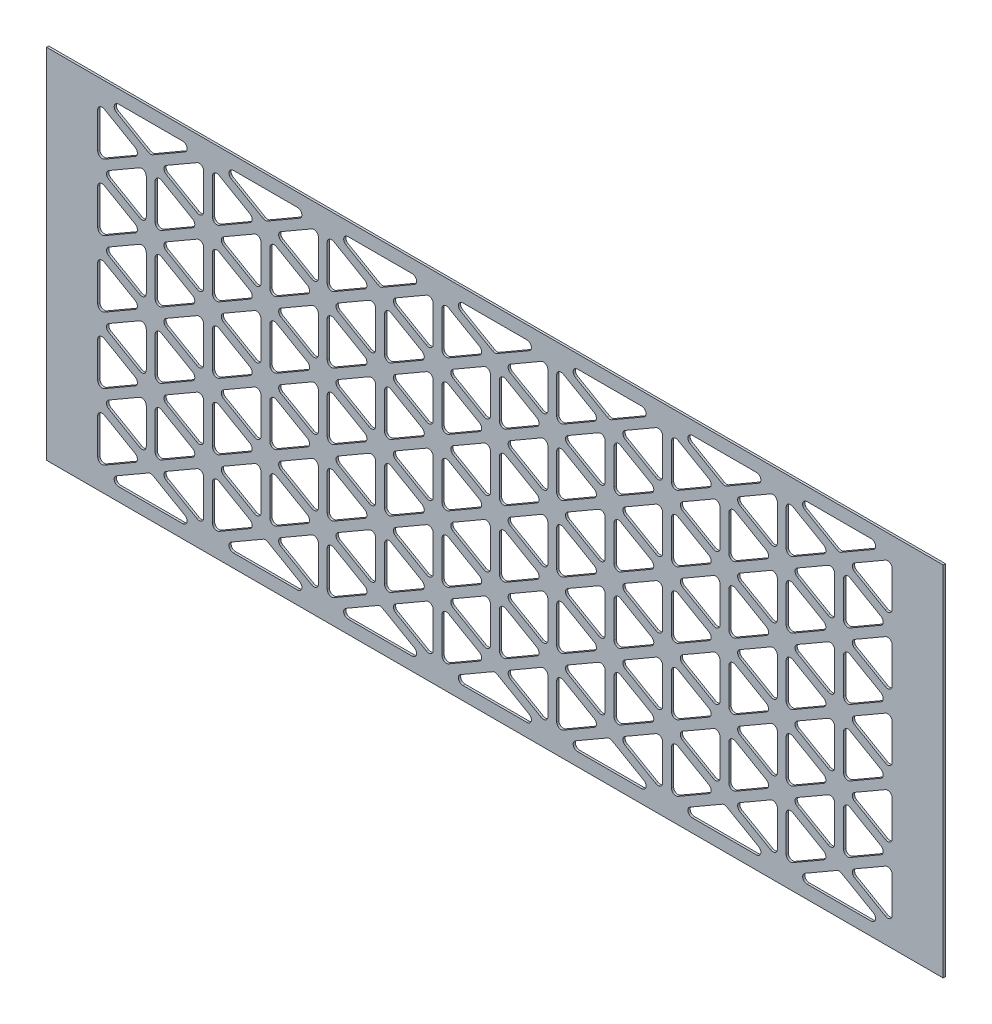
from build123d import *

# Parameters (mm, degrees)
SKETCH1_W                = 203
SKETCH1_H                = 81
BOSS_EXTRUDE1_DEPTH      = 0.25
CUT_EXTRUDE3_DEPTH       = 110.282889786
CUT_EXTRUDE4_DEPTH       = 110.282889786
LPATTERN2_COUNT          = 5
LPATTERN2_PITCH          = 15
LPATTERN3_COUNT          = 4
LPATTERN3_PITCH          = 15
MIRROR1_COPY_1_DEPTH     = 110.282889786
MIRROR1_COPY_2_DEPTH     = 110.282889786
MIRROR1_COPY_3_DEPTH     = 110.282889786
MIRROR1_COPY_4_DEPTH     = 110.282889786
MIRROR1_COPY_5_DEPTH     = 110.282889786
MIRROR1_COPY_6_DEPTH     = 110.282889786
MIRROR1_COPY_7_DEPTH     = 110.282889786
MIRROR1_COPY_8_DEPTH     = 110.282889786
MIRROR1_COPY_9_DEPTH     = 110.282889786
LPATTERN4_COPY_1_DEPTH   = 110.282889786
LPATTERN4_COPY_2_DEPTH   = 110.282889786
LPATTERN4_COPY_3_DEPTH   = 110.282889786
LPATTERN4_COPY_4_DEPTH   = 110.282889786
LPATTERN4_COPY_5_DEPTH   = 110.282889786
LPATTERN4_COPY_6_DEPTH   = 110.282889786
LPATTERN4_COPY_7_DEPTH   = 110.282889786
LPATTERN4_COPY_8_DEPTH   = 110.282889786
LPATTERN4_COPY_9_DEPTH   = 110.282889786
LPATTERN4_COPY_10_DEPTH  = 110.282889786
LPATTERN4_COPY_11_DEPTH  = 110.282889786
LPATTERN4_COPY_12_DEPTH  = 110.282889786
LPATTERN4_COPY_13_DEPTH  = 110.282889786
LPATTERN4_COPY_14_DEPTH  = 110.282889786
LPATTERN4_COPY_15_DEPTH  = 110.282889786
LPATTERN4_COPY_16_DEPTH  = 110.282889786
LPATTERN4_COPY_17_DEPTH  = 110.282889786
LPATTERN4_COPY_18_DEPTH  = 110.282889786
LPATTERN4_COPY_19_DEPTH  = 110.282889786
LPATTERN4_COPY_20_DEPTH  = 110.282889786
LPATTERN4_COPY_21_DEPTH  = 110.282889786
LPATTERN4_COPY_22_DEPTH  = 110.282889786
LPATTERN4_COPY_23_DEPTH  = 110.282889786
LPATTERN4_COPY_24_DEPTH  = 110.282889786
LPATTERN4_COPY_25_DEPTH  = 110.282889786
LPATTERN4_COPY_26_DEPTH  = 110.282889786
LPATTERN4_COPY_27_DEPTH  = 110.282889786
LPATTERN4_COPY_28_DEPTH  = 110.282889786
LPATTERN4_COPY_29_DEPTH  = 110.282889786
LPATTERN4_COPY_30_DEPTH  = 110.282889786
LPATTERN4_COPY_31_DEPTH  = 110.282889786
LPATTERN4_COPY_32_DEPTH  = 110.282889786
LPATTERN4_COPY_33_DEPTH  = 110.282889786
LPATTERN4_COPY_34_DEPTH  = 110.282889786
LPATTERN4_COPY_35_DEPTH  = 110.282889786
LPATTERN4_COPY_36_DEPTH  = 110.282889786
LPATTERN4_COPY_37_DEPTH  = 110.282889786
LPATTERN4_COPY_38_DEPTH  = 110.282889786
LPATTERN4_COPY_39_DEPTH  = 110.282889786
LPATTERN4_COPY_40_DEPTH  = 110.282889786
LPATTERN4_COPY_41_DEPTH  = 110.282889786
LPATTERN4_COPY_42_DEPTH  = 110.282889786
LPATTERN4_COPY_43_DEPTH  = 110.282889786
LPATTERN4_COPY_44_DEPTH  = 110.282889786
LPATTERN4_COPY_45_DEPTH  = 110.282889786
LPATTERN4_COPY_46_DEPTH  = 110.282889786
LPATTERN4_COPY_47_DEPTH  = 110.282889786
LPATTERN4_COPY_48_DEPTH  = 110.282889786
LPATTERN4_COPY_49_DEPTH  = 110.282889786
LPATTERN4_COPY_50_DEPTH  = 110.282889786
LPATTERN4_COPY_51_DEPTH  = 110.282889786
LPATTERN4_COPY_52_DEPTH  = 110.282889786
LPATTERN4_COPY_53_DEPTH  = 110.282889786
LPATTERN4_COPY_54_DEPTH  = 110.282889786
LPATTERN4_COPY_55_DEPTH  = 110.282889786
LPATTERN4_COPY_56_DEPTH  = 110.282889786
LPATTERN4_COPY_57_DEPTH  = 110.282889786
LPATTERN4_COPY_58_DEPTH  = 110.282889786
LPATTERN4_COPY_59_DEPTH  = 110.282889786
LPATTERN4_COPY_60_DEPTH  = 110.282889786
LPATTERN4_COPY_61_DEPTH  = 110.282889786
LPATTERN4_COPY_62_DEPTH  = 110.282889786
LPATTERN4_COPY_63_DEPTH  = 110.282889786
LPATTERN4_COPY_64_DEPTH  = 110.282889786
LPATTERN4_COPY_65_DEPTH  = 110.282889786
LPATTERN4_COPY_66_DEPTH  = 110.282889786
LPATTERN4_COPY_67_DEPTH  = 110.282889786
LPATTERN4_COPY_68_DEPTH  = 110.282889786
LPATTERN4_COPY_69_DEPTH  = 110.282889786
LPATTERN4_COPY_70_DEPTH  = 110.282889786
LPATTERN4_COPY_71_DEPTH  = 110.282889786
LPATTERN4_COPY_72_DEPTH  = 110.282889786
LPATTERN4_COPY_73_DEPTH  = 110.282889786
LPATTERN4_COPY_74_DEPTH  = 110.282889786
LPATTERN4_COPY_75_DEPTH  = 110.282889786
LPATTERN4_COPY_76_DEPTH  = 110.282889786
LPATTERN4_COPY_77_DEPTH  = 110.282889786
LPATTERN4_COPY_78_DEPTH  = 110.282889786
LPATTERN4_COPY_79_DEPTH  = 110.282889786
LPATTERN4_COPY_80_DEPTH  = 110.282889786
LPATTERN4_COPY_81_DEPTH  = 110.282889786
LPATTERN4_COPY_82_DEPTH  = 110.282889786
LPATTERN4_COPY_83_DEPTH  = 110.282889786
LPATTERN4_COPY_84_DEPTH  = 110.282889786
LPATTERN4_COPY_85_DEPTH  = 110.282889786
LPATTERN4_COPY_86_DEPTH  = 110.282889786
LPATTERN4_COPY_87_DEPTH  = 110.282889786
LPATTERN4_COPY_88_DEPTH  = 110.282889786
LPATTERN4_COPY_89_DEPTH  = 110.282889786
LPATTERN4_COPY_90_DEPTH  = 110.282889786
LPATTERN4_COPY_91_DEPTH  = 110.282889786
LPATTERN4_COPY_92_DEPTH  = 110.282889786
LPATTERN4_COPY_93_DEPTH  = 110.282889786
LPATTERN4_COPY_94_DEPTH  = 110.282889786
LPATTERN4_COPY_95_DEPTH  = 110.282889786
LPATTERN4_COPY_96_DEPTH  = 110.282889786
LPATTERN4_COPY_97_DEPTH  = 110.282889786
LPATTERN4_COPY_98_DEPTH  = 110.282889786
LPATTERN4_COPY_99_DEPTH  = 110.282889786
LPATTERN4_COPY_100_DEPTH = 110.282889786
LPATTERN4_COPY_101_DEPTH = 110.282889786
LPATTERN4_COPY_102_DEPTH = 110.282889786
LPATTERN4_COPY_103_DEPTH = 110.282889786
LPATTERN4_COPY_104_DEPTH = 110.282889786
LPATTERN4_COPY_105_DEPTH = 110.282889786
LPATTERN4_COPY_106_DEPTH = 110.282889786
LPATTERN4_COPY_107_DEPTH = 110.282889786
LPATTERN4_COPY_108_DEPTH = 110.282889786
LPATTERN4_COPY_109_DEPTH = 110.282889786
LPATTERN4_COPY_110_DEPTH = 110.282889786
LPATTERN4_COPY_111_DEPTH = 110.282889786
LPATTERN4_COPY_112_DEPTH = 110.282889786
LPATTERN4_COPY_113_DEPTH = 110.282889786
LPATTERN4_COPY_114_DEPTH = 110.282889786
LPATTERN4_COPY_115_DEPTH = 110.282889786
LPATTERN4_COPY_116_DEPTH = 110.282889786
LPATTERN4_COPY_117_DEPTH = 110.282889786
LPATTERN4_COPY_118_DEPTH = 110.282889786
LPATTERN4_COPY_119_DEPTH = 110.282889786
LPATTERN4_COPY_120_DEPTH = 110.282889786
CUT_EXTRUDE5_DEPTH       = 110.282889786
LPATTERN5_COUNT          = 7
LPATTERN5_PITCH          = 25.98
MIRROR2_COPY_1_DEPTH     = 110.282889786
MIRROR2_COPY_2_DEPTH     = 110.282889786
MIRROR2_COPY_3_DEPTH     = 110.282889786
MIRROR2_COPY_4_DEPTH     = 110.282889786
MIRROR2_COPY_5_DEPTH     = 110.282889786
MIRROR2_COPY_6_DEPTH     = 110.282889786
MIRROR2_COPY_7_DEPTH     = 110.282889786


with BuildPart() as part:
    # Sketch1 → Boss-Extrude1 (new, symmetric)
    with BuildSketch(Plane.XY):
        Rectangle(SKETCH1_W, SKETCH1_H)
    extrude(amount=BOSS_EXTRUDE1_DEPTH, both=True)

    # Sketch3 → Cut-Extrude3 (cut, through all)
    with BuildSketch(Plane.XY.offset(0.25)):
        with BuildLine():
            Line((-89.93, -25.964101615), (-89.93, -34.035898385))
            ThreePointArc((-89.93, -34.035898385), (-89.43, -34.901923789), (-88.43, -34.901923789))
            Line((-88.43, -34.901923789), (-81.439618943, -30.866025404))
            ThreePointArc((-81.439618943, -30.866025404), (-80.939618943, -30), (-81.439618943, -29.133974596))
            Line((-81.439618943, -29.133974596), (-88.43, -25.098076211))
            ThreePointArc((-88.43, -25.098076211), (-89.43, -25.098076211), (-89.93, -25.964101615))
        make_face()
    cut_extrude3 = extrude(amount=-CUT_EXTRUDE3_DEPTH, mode=Mode.SUBTRACT)

    # Sketch3<5> → Cut-Extrude4 (cut, through all)
    with BuildSketch(Plane.XY.offset(0.25)):
        with BuildLine():
            Line((-78.939618943, -18.464101615), (-78.939618943, -26.535898385))
            ThreePointArc((-78.939618943, -26.535898385), (-79.439618943, -27.401923789), (-80.439618943, -27.401923789))
            Line((-80.439618943, -27.401923789), (-87.43, -23.366025404))
            ThreePointArc((-87.43, -23.366025404), (-87.93, -22.5), (-87.43, -21.633974596))
            Line((-87.43, -21.633974596), (-80.439618943, -17.598076211))
            ThreePointArc((-80.439618943, -17.598076211), (-79.439618943, -17.598076211), (-78.939618943, -18.464101615))
        make_face()
    cut_extrude4 = extrude(amount=-CUT_EXTRUDE4_DEPTH, mode=Mode.SUBTRACT)

    # LPattern2: Cut-Extrude3 ×5
    with Locations(*[(0, i * LPATTERN2_PITCH, 0) for i in range(1, LPATTERN2_COUNT)]):
        add(cut_extrude3, mode=Mode.SUBTRACT)

    # LPattern3: Cut-Extrude4 ×4
    with Locations(*[(0, i * LPATTERN3_PITCH, 0) for i in range(1, LPATTERN3_COUNT)]):
        add(cut_extrude4, mode=Mode.SUBTRACT)

    # Mirror1 copy 1 sketch → Mirror1 copy 1 (cut, through all)
    with BuildSketch(Plane(origin=(-155.879237886, 15, 0.25), x_dir=(-1, 0, 0), z_dir=(0, 0, 1))):
        with BuildLine():
            Line((-89.93, 25.964101615), (-89.93, 34.035898385))
            ThreePointArc((-89.93, 34.035898385), (-89.43, 34.901923789), (-88.43, 34.901923789))
            Line((-88.43, 34.901923789), (-81.439618943, 30.866025404))
            ThreePointArc((-81.439618943, 30.866025404), (-80.939618943, 30), (-81.439618943, 29.133974596))
            Line((-81.439618943, 29.133974596), (-88.43, 25.098076211))
            ThreePointArc((-88.43, 25.098076211), (-89.43, 25.098076211), (-89.93, 25.964101615))
        make_face()
    extrude(amount=-MIRROR1_COPY_1_DEPTH, mode=Mode.SUBTRACT)

    # Mirror1 copy 2 sketch → Mirror1 copy 2 (cut, through all)
    with BuildSketch(Plane(origin=(-155.879237886, 30, 0.25), x_dir=(-1, 0, 0), z_dir=(0, 0, 1))):
        with BuildLine():
            Line((-89.93, 25.964101615), (-89.93, 34.035898385))
            ThreePointArc((-89.93, 34.035898385), (-89.43, 34.901923789), (-88.43, 34.901923789))
            Line((-88.43, 34.901923789), (-81.439618943, 30.866025404))
            ThreePointArc((-81.439618943, 30.866025404), (-80.939618943, 30), (-81.439618943, 29.133974596))
            Line((-81.439618943, 29.133974596), (-88.43, 25.098076211))
            ThreePointArc((-88.43, 25.098076211), (-89.43, 25.098076211), (-89.93, 25.964101615))
        make_face()
    extrude(amount=-MIRROR1_COPY_2_DEPTH, mode=Mode.SUBTRACT)

    # Mirror1 copy 3 sketch → Mirror1 copy 3 (cut, through all)
    with BuildSketch(Plane(origin=(-155.879237886, 45, 0.25), x_dir=(-1, 0, 0), z_dir=(0, 0, 1))):
        with BuildLine():
            Line((-89.93, 25.964101615), (-89.93, 34.035898385))
            ThreePointArc((-89.93, 34.035898385), (-89.43, 34.901923789), (-88.43, 34.901923789))
            Line((-88.43, 34.901923789), (-81.439618943, 30.866025404))
            ThreePointArc((-81.439618943, 30.866025404), (-80.939618943, 30), (-81.439618943, 29.133974596))
            Line((-81.439618943, 29.133974596), (-88.43, 25.098076211))
            ThreePointArc((-88.43, 25.098076211), (-89.43, 25.098076211), (-89.93, 25.964101615))
        make_face()
    extrude(amount=-MIRROR1_COPY_3_DEPTH, mode=Mode.SUBTRACT)

    # Mirror1 copy 4 sketch → Mirror1 copy 4 (cut, through all)
    with BuildSketch(Plane(origin=(-155.879237886, 60, 0.25), x_dir=(-1, 0, 0), z_dir=(0, 0, 1))):
        with BuildLine():
            Line((-89.93, 25.964101615), (-89.93, 34.035898385))
            ThreePointArc((-89.93, 34.035898385), (-89.43, 34.901923789), (-88.43, 34.901923789))
            Line((-88.43, 34.901923789), (-81.439618943, 30.866025404))
            ThreePointArc((-81.439618943, 30.866025404), (-80.939618943, 30), (-81.439618943, 29.133974596))
            Line((-81.439618943, 29.133974596), (-88.43, 25.098076211))
            ThreePointArc((-88.43, 25.098076211), (-89.43, 25.098076211), (-89.93, 25.964101615))
        make_face()
    extrude(amount=-MIRROR1_COPY_4_DEPTH, mode=Mode.SUBTRACT)

    # Mirror1 copy 5 sketch → Mirror1 copy 5 (cut, through all)
    with BuildSketch(Plane(origin=(-155.879237886, 0, 0.25), x_dir=(-1, 0, 0), z_dir=(0, 0, 1))):
        with BuildLine():
            Line((-89.93, 25.964101615), (-89.93, 34.035898385))
            ThreePointArc((-89.93, 34.035898385), (-89.43, 34.901923789), (-88.43, 34.901923789))
            Line((-88.43, 34.901923789), (-81.439618943, 30.866025404))
            ThreePointArc((-81.439618943, 30.866025404), (-80.939618943, 30), (-81.439618943, 29.133974596))
            Line((-81.439618943, 29.133974596), (-88.43, 25.098076211))
            ThreePointArc((-88.43, 25.098076211), (-89.43, 25.098076211), (-89.93, 25.964101615))
        make_face()
    extrude(amount=-MIRROR1_COPY_5_DEPTH, mode=Mode.SUBTRACT)

    # Mirror1 copy 6 sketch → Mirror1 copy 6 (cut, through all)
    with BuildSketch(Plane(origin=(-155.879237886, 15, 0.25), x_dir=(-1, 0, 0), z_dir=(0, 0, 1))):
        with BuildLine():
            Line((-78.939618943, 18.464101615), (-78.939618943, 26.535898385))
            ThreePointArc((-78.939618943, 26.535898385), (-79.439618943, 27.401923789), (-80.439618943, 27.401923789))
            Line((-80.439618943, 27.401923789), (-87.43, 23.366025404))
            ThreePointArc((-87.43, 23.366025404), (-87.93, 22.5), (-87.43, 21.633974596))
            Line((-87.43, 21.633974596), (-80.439618943, 17.598076211))
            ThreePointArc((-80.439618943, 17.598076211), (-79.439618943, 17.598076211), (-78.939618943, 18.464101615))
        make_face()
    extrude(amount=-MIRROR1_COPY_6_DEPTH, mode=Mode.SUBTRACT)

    # Mirror1 copy 7 sketch → Mirror1 copy 7 (cut, through all)
    with BuildSketch(Plane(origin=(-155.879237886, 30, 0.25), x_dir=(-1, 0, 0), z_dir=(0, 0, 1))):
        with BuildLine():
            Line((-78.939618943, 18.464101615), (-78.939618943, 26.535898385))
            ThreePointArc((-78.939618943, 26.535898385), (-79.439618943, 27.401923789), (-80.439618943, 27.401923789))
            Line((-80.439618943, 27.401923789), (-87.43, 23.366025404))
            ThreePointArc((-87.43, 23.366025404), (-87.93, 22.5), (-87.43, 21.633974596))
            Line((-87.43, 21.633974596), (-80.439618943, 17.598076211))
            ThreePointArc((-80.439618943, 17.598076211), (-79.439618943, 17.598076211), (-78.939618943, 18.464101615))
        make_face()
    extrude(amount=-MIRROR1_COPY_7_DEPTH, mode=Mode.SUBTRACT)

    # Mirror1 copy 8 sketch → Mirror1 copy 8 (cut, through all)
    with BuildSketch(Plane(origin=(-155.879237886, 45, 0.25), x_dir=(-1, 0, 0), z_dir=(0, 0, 1))):
        with BuildLine():
            Line((-78.939618943, 18.464101615), (-78.939618943, 26.535898385))
            ThreePointArc((-78.939618943, 26.535898385), (-79.439618943, 27.401923789), (-80.439618943, 27.401923789))
            Line((-80.439618943, 27.401923789), (-87.43, 23.366025404))
            ThreePointArc((-87.43, 23.366025404), (-87.93, 22.5), (-87.43, 21.633974596))
            Line((-87.43, 21.633974596), (-80.439618943, 17.598076211))
            ThreePointArc((-80.439618943, 17.598076211), (-79.439618943, 17.598076211), (-78.939618943, 18.464101615))
        make_face()
    extrude(amount=-MIRROR1_COPY_8_DEPTH, mode=Mode.SUBTRACT)

    # Mirror1 copy 9 sketch → Mirror1 copy 9 (cut, through all)
    with BuildSketch(Plane(origin=(-155.879237886, 0, 0.25), x_dir=(-1, 0, 0), z_dir=(0, 0, 1))):
        with BuildLine():
            Line((-78.939618943, 18.464101615), (-78.939618943, 26.535898385))
            ThreePointArc((-78.939618943, 26.535898385), (-79.439618943, 27.401923789), (-80.439618943, 27.401923789))
            Line((-80.439618943, 27.401923789), (-87.43, 23.366025404))
            ThreePointArc((-87.43, 23.366025404), (-87.93, 22.5), (-87.43, 21.633974596))
            Line((-87.43, 21.633974596), (-80.439618943, 17.598076211))
            ThreePointArc((-80.439618943, 17.598076211), (-79.439618943, 17.598076211), (-78.939618943, 18.464101615))
        make_face()
    extrude(amount=-MIRROR1_COPY_9_DEPTH, mode=Mode.SUBTRACT)

    # LPattern4 copy 1 sketch → LPattern4 copy 1 (cut, through all)
    with BuildSketch(Plane(origin=(25.98, 15, 0.25), x_dir=(1, 0, 0), z_dir=(0, 0, 1))):
        with BuildLine():
            Line((-89.93, -25.964101615), (-89.93, -34.035898385))
            ThreePointArc((-89.93, -34.035898385), (-89.43, -34.901923789), (-88.43, -34.901923789))
            Line((-88.43, -34.901923789), (-81.439618943, -30.866025404))
            ThreePointArc((-81.439618943, -30.866025404), (-80.939618943, -30), (-81.439618943, -29.133974596))
            Line((-81.439618943, -29.133974596), (-88.43, -25.098076211))
            ThreePointArc((-88.43, -25.098076211), (-89.43, -25.098076211), (-89.93, -25.964101615))
        make_face()
    extrude(amount=-LPATTERN4_COPY_1_DEPTH, mode=Mode.SUBTRACT)

    # LPattern4 copy 2 sketch → LPattern4 copy 2 (cut, through all)
    with BuildSketch(Plane(origin=(51.96, 15, 0.25), x_dir=(1, 0, 0), z_dir=(0, 0, 1))):
        with BuildLine():
            Line((-89.93, -25.964101615), (-89.93, -34.035898385))
            ThreePointArc((-89.93, -34.035898385), (-89.43, -34.901923789), (-88.43, -34.901923789))
            Line((-88.43, -34.901923789), (-81.439618943, -30.866025404))
            ThreePointArc((-81.439618943, -30.866025404), (-80.939618943, -30), (-81.439618943, -29.133974596))
            Line((-81.439618943, -29.133974596), (-88.43, -25.098076211))
            ThreePointArc((-88.43, -25.098076211), (-89.43, -25.098076211), (-89.93, -25.964101615))
        make_face()
    extrude(amount=-LPATTERN4_COPY_2_DEPTH, mode=Mode.SUBTRACT)

    # LPattern4 copy 3 sketch → LPattern4 copy 3 (cut, through all)
    with BuildSketch(Plane(origin=(77.94, 15, 0.25), x_dir=(1, 0, 0), z_dir=(0, 0, 1))):
        with BuildLine():
            Line((-89.93, -25.964101615), (-89.93, -34.035898385))
            ThreePointArc((-89.93, -34.035898385), (-89.43, -34.901923789), (-88.43, -34.901923789))
            Line((-88.43, -34.901923789), (-81.439618943, -30.866025404))
            ThreePointArc((-81.439618943, -30.866025404), (-80.939618943, -30), (-81.439618943, -29.133974596))
            Line((-81.439618943, -29.133974596), (-88.43, -25.098076211))
            ThreePointArc((-88.43, -25.098076211), (-89.43, -25.098076211), (-89.93, -25.964101615))
        make_face()
    extrude(amount=-LPATTERN4_COPY_3_DEPTH, mode=Mode.SUBTRACT)

    # LPattern4 copy 4 sketch → LPattern4 copy 4 (cut, through all)
    with BuildSketch(Plane(origin=(103.92, 15, 0.25), x_dir=(1, 0, 0), z_dir=(0, 0, 1))):
        with BuildLine():
            Line((-89.93, -25.964101615), (-89.93, -34.035898385))
            ThreePointArc((-89.93, -34.035898385), (-89.43, -34.901923789), (-88.43, -34.901923789))
            Line((-88.43, -34.901923789), (-81.439618943, -30.866025404))
            ThreePointArc((-81.439618943, -30.866025404), (-80.939618943, -30), (-81.439618943, -29.133974596))
            Line((-81.439618943, -29.133974596), (-88.43, -25.098076211))
            ThreePointArc((-88.43, -25.098076211), (-89.43, -25.098076211), (-89.93, -25.964101615))
        make_face()
    extrude(amount=-LPATTERN4_COPY_4_DEPTH, mode=Mode.SUBTRACT)

    # LPattern4 copy 5 sketch → LPattern4 copy 5 (cut, through all)
    with BuildSketch(Plane(origin=(129.9, 15, 0.25), x_dir=(1, 0, 0), z_dir=(0, 0, 1))):
        with BuildLine():
            Line((-89.93, -25.964101615), (-89.93, -34.035898385))
            ThreePointArc((-89.93, -34.035898385), (-89.43, -34.901923789), (-88.43, -34.901923789))
            Line((-88.43, -34.901923789), (-81.439618943, -30.866025404))
            ThreePointArc((-81.439618943, -30.866025404), (-80.939618943, -30), (-81.439618943, -29.133974596))
            Line((-81.439618943, -29.133974596), (-88.43, -25.098076211))
            ThreePointArc((-88.43, -25.098076211), (-89.43, -25.098076211), (-89.93, -25.964101615))
        make_face()
    extrude(amount=-LPATTERN4_COPY_5_DEPTH, mode=Mode.SUBTRACT)

    # LPattern4 copy 6 sketch → LPattern4 copy 6 (cut, through all)
    with BuildSketch(Plane(origin=(155.88, 15, 0.25), x_dir=(1, 0, 0), z_dir=(0, 0, 1))):
        with BuildLine():
            Line((-89.93, -25.964101615), (-89.93, -34.035898385))
            ThreePointArc((-89.93, -34.035898385), (-89.43, -34.901923789), (-88.43, -34.901923789))
            Line((-88.43, -34.901923789), (-81.439618943, -30.866025404))
            ThreePointArc((-81.439618943, -30.866025404), (-80.939618943, -30), (-81.439618943, -29.133974596))
            Line((-81.439618943, -29.133974596), (-88.43, -25.098076211))
            ThreePointArc((-88.43, -25.098076211), (-89.43, -25.098076211), (-89.93, -25.964101615))
        make_face()
    extrude(amount=-LPATTERN4_COPY_6_DEPTH, mode=Mode.SUBTRACT)

    # LPattern4 copy 7 sketch → LPattern4 copy 7 (cut, through all)
    with BuildSketch(Plane(origin=(25.98, 30, 0.25), x_dir=(1, 0, 0), z_dir=(0, 0, 1))):
        with BuildLine():
            Line((-89.93, -25.964101615), (-89.93, -34.035898385))
            ThreePointArc((-89.93, -34.035898385), (-89.43, -34.901923789), (-88.43, -34.901923789))
            Line((-88.43, -34.901923789), (-81.439618943, -30.866025404))
            ThreePointArc((-81.439618943, -30.866025404), (-80.939618943, -30), (-81.439618943, -29.133974596))
            Line((-81.439618943, -29.133974596), (-88.43, -25.098076211))
            ThreePointArc((-88.43, -25.098076211), (-89.43, -25.098076211), (-89.93, -25.964101615))
        make_face()
    extrude(amount=-LPATTERN4_COPY_7_DEPTH, mode=Mode.SUBTRACT)

    # LPattern4 copy 8 sketch → LPattern4 copy 8 (cut, through all)
    with BuildSketch(Plane(origin=(51.96, 30, 0.25), x_dir=(1, 0, 0), z_dir=(0, 0, 1))):
        with BuildLine():
            Line((-89.93, -25.964101615), (-89.93, -34.035898385))
            ThreePointArc((-89.93, -34.035898385), (-89.43, -34.901923789), (-88.43, -34.901923789))
            Line((-88.43, -34.901923789), (-81.439618943, -30.866025404))
            ThreePointArc((-81.439618943, -30.866025404), (-80.939618943, -30), (-81.439618943, -29.133974596))
            Line((-81.439618943, -29.133974596), (-88.43, -25.098076211))
            ThreePointArc((-88.43, -25.098076211), (-89.43, -25.098076211), (-89.93, -25.964101615))
        make_face()
    extrude(amount=-LPATTERN4_COPY_8_DEPTH, mode=Mode.SUBTRACT)

    # LPattern4 copy 9 sketch → LPattern4 copy 9 (cut, through all)
    with BuildSketch(Plane(origin=(77.94, 30, 0.25), x_dir=(1, 0, 0), z_dir=(0, 0, 1))):
        with BuildLine():
            Line((-89.93, -25.964101615), (-89.93, -34.035898385))
            ThreePointArc((-89.93, -34.035898385), (-89.43, -34.901923789), (-88.43, -34.901923789))
            Line((-88.43, -34.901923789), (-81.439618943, -30.866025404))
            ThreePointArc((-81.439618943, -30.866025404), (-80.939618943, -30), (-81.439618943, -29.133974596))
            Line((-81.439618943, -29.133974596), (-88.43, -25.098076211))
            ThreePointArc((-88.43, -25.098076211), (-89.43, -25.098076211), (-89.93, -25.964101615))
        make_face()
    extrude(amount=-LPATTERN4_COPY_9_DEPTH, mode=Mode.SUBTRACT)

    # LPattern4 copy 10 sketch → LPattern4 copy 10 (cut, through all)
    with BuildSketch(Plane(origin=(103.92, 30, 0.25), x_dir=(1, 0, 0), z_dir=(0, 0, 1))):
        with BuildLine():
            Line((-89.93, -25.964101615), (-89.93, -34.035898385))
            ThreePointArc((-89.93, -34.035898385), (-89.43, -34.901923789), (-88.43, -34.901923789))
            Line((-88.43, -34.901923789), (-81.439618943, -30.866025404))
            ThreePointArc((-81.439618943, -30.866025404), (-80.939618943, -30), (-81.439618943, -29.133974596))
            Line((-81.439618943, -29.133974596), (-88.43, -25.098076211))
            ThreePointArc((-88.43, -25.098076211), (-89.43, -25.098076211), (-89.93, -25.964101615))
        make_face()
    extrude(amount=-LPATTERN4_COPY_10_DEPTH, mode=Mode.SUBTRACT)

    # LPattern4 copy 11 sketch → LPattern4 copy 11 (cut, through all)
    with BuildSketch(Plane(origin=(129.9, 30, 0.25), x_dir=(1, 0, 0), z_dir=(0, 0, 1))):
        with BuildLine():
            Line((-89.93, -25.964101615), (-89.93, -34.035898385))
            ThreePointArc((-89.93, -34.035898385), (-89.43, -34.901923789), (-88.43, -34.901923789))
            Line((-88.43, -34.901923789), (-81.439618943, -30.866025404))
            ThreePointArc((-81.439618943, -30.866025404), (-80.939618943, -30), (-81.439618943, -29.133974596))
            Line((-81.439618943, -29.133974596), (-88.43, -25.098076211))
            ThreePointArc((-88.43, -25.098076211), (-89.43, -25.098076211), (-89.93, -25.964101615))
        make_face()
    extrude(amount=-LPATTERN4_COPY_11_DEPTH, mode=Mode.SUBTRACT)

    # LPattern4 copy 12 sketch → LPattern4 copy 12 (cut, through all)
    with BuildSketch(Plane(origin=(155.88, 30, 0.25), x_dir=(1, 0, 0), z_dir=(0, 0, 1))):
        with BuildLine():
            Line((-89.93, -25.964101615), (-89.93, -34.035898385))
            ThreePointArc((-89.93, -34.035898385), (-89.43, -34.901923789), (-88.43, -34.901923789))
            Line((-88.43, -34.901923789), (-81.439618943, -30.866025404))
            ThreePointArc((-81.439618943, -30.866025404), (-80.939618943, -30), (-81.439618943, -29.133974596))
            Line((-81.439618943, -29.133974596), (-88.43, -25.098076211))
            ThreePointArc((-88.43, -25.098076211), (-89.43, -25.098076211), (-89.93, -25.964101615))
        make_face()
    extrude(amount=-LPATTERN4_COPY_12_DEPTH, mode=Mode.SUBTRACT)

    # LPattern4 copy 13 sketch → LPattern4 copy 13 (cut, through all)
    with BuildSketch(Plane(origin=(25.98, 45, 0.25), x_dir=(1, 0, 0), z_dir=(0, 0, 1))):
        with BuildLine():
            Line((-89.93, -25.964101615), (-89.93, -34.035898385))
            ThreePointArc((-89.93, -34.035898385), (-89.43, -34.901923789), (-88.43, -34.901923789))
            Line((-88.43, -34.901923789), (-81.439618943, -30.866025404))
            ThreePointArc((-81.439618943, -30.866025404), (-80.939618943, -30), (-81.439618943, -29.133974596))
            Line((-81.439618943, -29.133974596), (-88.43, -25.098076211))
            ThreePointArc((-88.43, -25.098076211), (-89.43, -25.098076211), (-89.93, -25.964101615))
        make_face()
    extrude(amount=-LPATTERN4_COPY_13_DEPTH, mode=Mode.SUBTRACT)

    # LPattern4 copy 14 sketch → LPattern4 copy 14 (cut, through all)
    with BuildSketch(Plane(origin=(51.96, 45, 0.25), x_dir=(1, 0, 0), z_dir=(0, 0, 1))):
        with BuildLine():
            Line((-89.93, -25.964101615), (-89.93, -34.035898385))
            ThreePointArc((-89.93, -34.035898385), (-89.43, -34.901923789), (-88.43, -34.901923789))
            Line((-88.43, -34.901923789), (-81.439618943, -30.866025404))
            ThreePointArc((-81.439618943, -30.866025404), (-80.939618943, -30), (-81.439618943, -29.133974596))
            Line((-81.439618943, -29.133974596), (-88.43, -25.098076211))
            ThreePointArc((-88.43, -25.098076211), (-89.43, -25.098076211), (-89.93, -25.964101615))
        make_face()
    extrude(amount=-LPATTERN4_COPY_14_DEPTH, mode=Mode.SUBTRACT)

    # LPattern4 copy 15 sketch → LPattern4 copy 15 (cut, through all)
    with BuildSketch(Plane(origin=(77.94, 45, 0.25), x_dir=(1, 0, 0), z_dir=(0, 0, 1))):
        with BuildLine():
            Line((-89.93, -25.964101615), (-89.93, -34.035898385))
            ThreePointArc((-89.93, -34.035898385), (-89.43, -34.901923789), (-88.43, -34.901923789))
            Line((-88.43, -34.901923789), (-81.439618943, -30.866025404))
            ThreePointArc((-81.439618943, -30.866025404), (-80.939618943, -30), (-81.439618943, -29.133974596))
            Line((-81.439618943, -29.133974596), (-88.43, -25.098076211))
            ThreePointArc((-88.43, -25.098076211), (-89.43, -25.098076211), (-89.93, -25.964101615))
        make_face()
    extrude(amount=-LPATTERN4_COPY_15_DEPTH, mode=Mode.SUBTRACT)

    # LPattern4 copy 16 sketch → LPattern4 copy 16 (cut, through all)
    with BuildSketch(Plane(origin=(103.92, 45, 0.25), x_dir=(1, 0, 0), z_dir=(0, 0, 1))):
        with BuildLine():
            Line((-89.93, -25.964101615), (-89.93, -34.035898385))
            ThreePointArc((-89.93, -34.035898385), (-89.43, -34.901923789), (-88.43, -34.901923789))
            Line((-88.43, -34.901923789), (-81.439618943, -30.866025404))
            ThreePointArc((-81.439618943, -30.866025404), (-80.939618943, -30), (-81.439618943, -29.133974596))
            Line((-81.439618943, -29.133974596), (-88.43, -25.098076211))
            ThreePointArc((-88.43, -25.098076211), (-89.43, -25.098076211), (-89.93, -25.964101615))
        make_face()
    extrude(amount=-LPATTERN4_COPY_16_DEPTH, mode=Mode.SUBTRACT)

    # LPattern4 copy 17 sketch → LPattern4 copy 17 (cut, through all)
    with BuildSketch(Plane(origin=(129.9, 45, 0.25), x_dir=(1, 0, 0), z_dir=(0, 0, 1))):
        with BuildLine():
            Line((-89.93, -25.964101615), (-89.93, -34.035898385))
            ThreePointArc((-89.93, -34.035898385), (-89.43, -34.901923789), (-88.43, -34.901923789))
            Line((-88.43, -34.901923789), (-81.439618943, -30.866025404))
            ThreePointArc((-81.439618943, -30.866025404), (-80.939618943, -30), (-81.439618943, -29.133974596))
            Line((-81.439618943, -29.133974596), (-88.43, -25.098076211))
            ThreePointArc((-88.43, -25.098076211), (-89.43, -25.098076211), (-89.93, -25.964101615))
        make_face()
    extrude(amount=-LPATTERN4_COPY_17_DEPTH, mode=Mode.SUBTRACT)

    # LPattern4 copy 18 sketch → LPattern4 copy 18 (cut, through all)
    with BuildSketch(Plane(origin=(155.88, 45, 0.25), x_dir=(1, 0, 0), z_dir=(0, 0, 1))):
        with BuildLine():
            Line((-89.93, -25.964101615), (-89.93, -34.035898385))
            ThreePointArc((-89.93, -34.035898385), (-89.43, -34.901923789), (-88.43, -34.901923789))
            Line((-88.43, -34.901923789), (-81.439618943, -30.866025404))
            ThreePointArc((-81.439618943, -30.866025404), (-80.939618943, -30), (-81.439618943, -29.133974596))
            Line((-81.439618943, -29.133974596), (-88.43, -25.098076211))
            ThreePointArc((-88.43, -25.098076211), (-89.43, -25.098076211), (-89.93, -25.964101615))
        make_face()
    extrude(amount=-LPATTERN4_COPY_18_DEPTH, mode=Mode.SUBTRACT)

    # LPattern4 copy 19 sketch → LPattern4 copy 19 (cut, through all)
    with BuildSketch(Plane(origin=(25.98, 60, 0.25), x_dir=(1, 0, 0), z_dir=(0, 0, 1))):
        with BuildLine():
            Line((-89.93, -25.964101615), (-89.93, -34.035898385))
            ThreePointArc((-89.93, -34.035898385), (-89.43, -34.901923789), (-88.43, -34.901923789))
            Line((-88.43, -34.901923789), (-81.439618943, -30.866025404))
            ThreePointArc((-81.439618943, -30.866025404), (-80.939618943, -30), (-81.439618943, -29.133974596))
            Line((-81.439618943, -29.133974596), (-88.43, -25.098076211))
            ThreePointArc((-88.43, -25.098076211), (-89.43, -25.098076211), (-89.93, -25.964101615))
        make_face()
    extrude(amount=-LPATTERN4_COPY_19_DEPTH, mode=Mode.SUBTRACT)

    # LPattern4 copy 20 sketch → LPattern4 copy 20 (cut, through all)
    with BuildSketch(Plane(origin=(51.96, 60, 0.25), x_dir=(1, 0, 0), z_dir=(0, 0, 1))):
        with BuildLine():
            Line((-89.93, -25.964101615), (-89.93, -34.035898385))
            ThreePointArc((-89.93, -34.035898385), (-89.43, -34.901923789), (-88.43, -34.901923789))
            Line((-88.43, -34.901923789), (-81.439618943, -30.866025404))
            ThreePointArc((-81.439618943, -30.866025404), (-80.939618943, -30), (-81.439618943, -29.133974596))
            Line((-81.439618943, -29.133974596), (-88.43, -25.098076211))
            ThreePointArc((-88.43, -25.098076211), (-89.43, -25.098076211), (-89.93, -25.964101615))
        make_face()
    extrude(amount=-LPATTERN4_COPY_20_DEPTH, mode=Mode.SUBTRACT)

    # LPattern4 copy 21 sketch → LPattern4 copy 21 (cut, through all)
    with BuildSketch(Plane(origin=(77.94, 60, 0.25), x_dir=(1, 0, 0), z_dir=(0, 0, 1))):
        with BuildLine():
            Line((-89.93, -25.964101615), (-89.93, -34.035898385))
            ThreePointArc((-89.93, -34.035898385), (-89.43, -34.901923789), (-88.43, -34.901923789))
            Line((-88.43, -34.901923789), (-81.439618943, -30.866025404))
            ThreePointArc((-81.439618943, -30.866025404), (-80.939618943, -30), (-81.439618943, -29.133974596))
            Line((-81.439618943, -29.133974596), (-88.43, -25.098076211))
            ThreePointArc((-88.43, -25.098076211), (-89.43, -25.098076211), (-89.93, -25.964101615))
        make_face()
    extrude(amount=-LPATTERN4_COPY_21_DEPTH, mode=Mode.SUBTRACT)

    # LPattern4 copy 22 sketch → LPattern4 copy 22 (cut, through all)
    with BuildSketch(Plane(origin=(103.92, 60, 0.25), x_dir=(1, 0, 0), z_dir=(0, 0, 1))):
        with BuildLine():
            Line((-89.93, -25.964101615), (-89.93, -34.035898385))
            ThreePointArc((-89.93, -34.035898385), (-89.43, -34.901923789), (-88.43, -34.901923789))
            Line((-88.43, -34.901923789), (-81.439618943, -30.866025404))
            ThreePointArc((-81.439618943, -30.866025404), (-80.939618943, -30), (-81.439618943, -29.133974596))
            Line((-81.439618943, -29.133974596), (-88.43, -25.098076211))
            ThreePointArc((-88.43, -25.098076211), (-89.43, -25.098076211), (-89.93, -25.964101615))
        make_face()
    extrude(amount=-LPATTERN4_COPY_22_DEPTH, mode=Mode.SUBTRACT)

    # LPattern4 copy 23 sketch → LPattern4 copy 23 (cut, through all)
    with BuildSketch(Plane(origin=(129.9, 60, 0.25), x_dir=(1, 0, 0), z_dir=(0, 0, 1))):
        with BuildLine():
            Line((-89.93, -25.964101615), (-89.93, -34.035898385))
            ThreePointArc((-89.93, -34.035898385), (-89.43, -34.901923789), (-88.43, -34.901923789))
            Line((-88.43, -34.901923789), (-81.439618943, -30.866025404))
            ThreePointArc((-81.439618943, -30.866025404), (-80.939618943, -30), (-81.439618943, -29.133974596))
            Line((-81.439618943, -29.133974596), (-88.43, -25.098076211))
            ThreePointArc((-88.43, -25.098076211), (-89.43, -25.098076211), (-89.93, -25.964101615))
        make_face()
    extrude(amount=-LPATTERN4_COPY_23_DEPTH, mode=Mode.SUBTRACT)

    # LPattern4 copy 24 sketch → LPattern4 copy 24 (cut, through all)
    with BuildSketch(Plane(origin=(155.88, 60, 0.25), x_dir=(1, 0, 0), z_dir=(0, 0, 1))):
        with BuildLine():
            Line((-89.93, -25.964101615), (-89.93, -34.035898385))
            ThreePointArc((-89.93, -34.035898385), (-89.43, -34.901923789), (-88.43, -34.901923789))
            Line((-88.43, -34.901923789), (-81.439618943, -30.866025404))
            ThreePointArc((-81.439618943, -30.866025404), (-80.939618943, -30), (-81.439618943, -29.133974596))
            Line((-81.439618943, -29.133974596), (-88.43, -25.098076211))
            ThreePointArc((-88.43, -25.098076211), (-89.43, -25.098076211), (-89.93, -25.964101615))
        make_face()
    extrude(amount=-LPATTERN4_COPY_24_DEPTH, mode=Mode.SUBTRACT)

    # LPattern4 copy 25 sketch → LPattern4 copy 25 (cut, through all)
    with BuildSketch(Plane(origin=(25.98, 0, 0.25), x_dir=(1, 0, 0), z_dir=(0, 0, 1))):
        with BuildLine():
            Line((-89.93, -25.964101615), (-89.93, -34.035898385))
            ThreePointArc((-89.93, -34.035898385), (-89.43, -34.901923789), (-88.43, -34.901923789))
            Line((-88.43, -34.901923789), (-81.439618943, -30.866025404))
            ThreePointArc((-81.439618943, -30.866025404), (-80.939618943, -30), (-81.439618943, -29.133974596))
            Line((-81.439618943, -29.133974596), (-88.43, -25.098076211))
            ThreePointArc((-88.43, -25.098076211), (-89.43, -25.098076211), (-89.93, -25.964101615))
        make_face()
    extrude(amount=-LPATTERN4_COPY_25_DEPTH, mode=Mode.SUBTRACT)

    # LPattern4 copy 26 sketch → LPattern4 copy 26 (cut, through all)
    with BuildSketch(Plane(origin=(51.96, 0, 0.25), x_dir=(1, 0, 0), z_dir=(0, 0, 1))):
        with BuildLine():
            Line((-89.93, -25.964101615), (-89.93, -34.035898385))
            ThreePointArc((-89.93, -34.035898385), (-89.43, -34.901923789), (-88.43, -34.901923789))
            Line((-88.43, -34.901923789), (-81.439618943, -30.866025404))
            ThreePointArc((-81.439618943, -30.866025404), (-80.939618943, -30), (-81.439618943, -29.133974596))
            Line((-81.439618943, -29.133974596), (-88.43, -25.098076211))
            ThreePointArc((-88.43, -25.098076211), (-89.43, -25.098076211), (-89.93, -25.964101615))
        make_face()
    extrude(amount=-LPATTERN4_COPY_26_DEPTH, mode=Mode.SUBTRACT)

    # LPattern4 copy 27 sketch → LPattern4 copy 27 (cut, through all)
    with BuildSketch(Plane(origin=(77.94, 0, 0.25), x_dir=(1, 0, 0), z_dir=(0, 0, 1))):
        with BuildLine():
            Line((-89.93, -25.964101615), (-89.93, -34.035898385))
            ThreePointArc((-89.93, -34.035898385), (-89.43, -34.901923789), (-88.43, -34.901923789))
            Line((-88.43, -34.901923789), (-81.439618943, -30.866025404))
            ThreePointArc((-81.439618943, -30.866025404), (-80.939618943, -30), (-81.439618943, -29.133974596))
            Line((-81.439618943, -29.133974596), (-88.43, -25.098076211))
            ThreePointArc((-88.43, -25.098076211), (-89.43, -25.098076211), (-89.93, -25.964101615))
        make_face()
    extrude(amount=-LPATTERN4_COPY_27_DEPTH, mode=Mode.SUBTRACT)

    # LPattern4 copy 28 sketch → LPattern4 copy 28 (cut, through all)
    with BuildSketch(Plane(origin=(103.92, 0, 0.25), x_dir=(1, 0, 0), z_dir=(0, 0, 1))):
        with BuildLine():
            Line((-89.93, -25.964101615), (-89.93, -34.035898385))
            ThreePointArc((-89.93, -34.035898385), (-89.43, -34.901923789), (-88.43, -34.901923789))
            Line((-88.43, -34.901923789), (-81.439618943, -30.866025404))
            ThreePointArc((-81.439618943, -30.866025404), (-80.939618943, -30), (-81.439618943, -29.133974596))
            Line((-81.439618943, -29.133974596), (-88.43, -25.098076211))
            ThreePointArc((-88.43, -25.098076211), (-89.43, -25.098076211), (-89.93, -25.964101615))
        make_face()
    extrude(amount=-LPATTERN4_COPY_28_DEPTH, mode=Mode.SUBTRACT)

    # LPattern4 copy 29 sketch → LPattern4 copy 29 (cut, through all)
    with BuildSketch(Plane(origin=(129.9, 0, 0.25), x_dir=(1, 0, 0), z_dir=(0, 0, 1))):
        with BuildLine():
            Line((-89.93, -25.964101615), (-89.93, -34.035898385))
            ThreePointArc((-89.93, -34.035898385), (-89.43, -34.901923789), (-88.43, -34.901923789))
            Line((-88.43, -34.901923789), (-81.439618943, -30.866025404))
            ThreePointArc((-81.439618943, -30.866025404), (-80.939618943, -30), (-81.439618943, -29.133974596))
            Line((-81.439618943, -29.133974596), (-88.43, -25.098076211))
            ThreePointArc((-88.43, -25.098076211), (-89.43, -25.098076211), (-89.93, -25.964101615))
        make_face()
    extrude(amount=-LPATTERN4_COPY_29_DEPTH, mode=Mode.SUBTRACT)

    # LPattern4 copy 30 sketch → LPattern4 copy 30 (cut, through all)
    with BuildSketch(Plane(origin=(155.88, 0, 0.25), x_dir=(1, 0, 0), z_dir=(0, 0, 1))):
        with BuildLine():
            Line((-89.93, -25.964101615), (-89.93, -34.035898385))
            ThreePointArc((-89.93, -34.035898385), (-89.43, -34.901923789), (-88.43, -34.901923789))
            Line((-88.43, -34.901923789), (-81.439618943, -30.866025404))
            ThreePointArc((-81.439618943, -30.866025404), (-80.939618943, -30), (-81.439618943, -29.133974596))
            Line((-81.439618943, -29.133974596), (-88.43, -25.098076211))
            ThreePointArc((-88.43, -25.098076211), (-89.43, -25.098076211), (-89.93, -25.964101615))
        make_face()
    extrude(amount=-LPATTERN4_COPY_30_DEPTH, mode=Mode.SUBTRACT)

    # LPattern4 copy 31 sketch → LPattern4 copy 31 (cut, through all)
    with BuildSketch(Plane(origin=(25.98, 15, 0.25), x_dir=(1, 0, 0), z_dir=(0, 0, 1))):
        with BuildLine():
            Line((-78.939618943, -18.464101615), (-78.939618943, -26.535898385))
            ThreePointArc((-78.939618943, -26.535898385), (-79.439618943, -27.401923789), (-80.439618943, -27.401923789))
            Line((-80.439618943, -27.401923789), (-87.43, -23.366025404))
            ThreePointArc((-87.43, -23.366025404), (-87.93, -22.5), (-87.43, -21.633974596))
            Line((-87.43, -21.633974596), (-80.439618943, -17.598076211))
            ThreePointArc((-80.439618943, -17.598076211), (-79.439618943, -17.598076211), (-78.939618943, -18.464101615))
        make_face()
    extrude(amount=-LPATTERN4_COPY_31_DEPTH, mode=Mode.SUBTRACT)

    # LPattern4 copy 32 sketch → LPattern4 copy 32 (cut, through all)
    with BuildSketch(Plane(origin=(51.96, 15, 0.25), x_dir=(1, 0, 0), z_dir=(0, 0, 1))):
        with BuildLine():
            Line((-78.939618943, -18.464101615), (-78.939618943, -26.535898385))
            ThreePointArc((-78.939618943, -26.535898385), (-79.439618943, -27.401923789), (-80.439618943, -27.401923789))
            Line((-80.439618943, -27.401923789), (-87.43, -23.366025404))
            ThreePointArc((-87.43, -23.366025404), (-87.93, -22.5), (-87.43, -21.633974596))
            Line((-87.43, -21.633974596), (-80.439618943, -17.598076211))
            ThreePointArc((-80.439618943, -17.598076211), (-79.439618943, -17.598076211), (-78.939618943, -18.464101615))
        make_face()
    extrude(amount=-LPATTERN4_COPY_32_DEPTH, mode=Mode.SUBTRACT)

    # LPattern4 copy 33 sketch → LPattern4 copy 33 (cut, through all)
    with BuildSketch(Plane(origin=(77.94, 15, 0.25), x_dir=(1, 0, 0), z_dir=(0, 0, 1))):
        with BuildLine():
            Line((-78.939618943, -18.464101615), (-78.939618943, -26.535898385))
            ThreePointArc((-78.939618943, -26.535898385), (-79.439618943, -27.401923789), (-80.439618943, -27.401923789))
            Line((-80.439618943, -27.401923789), (-87.43, -23.366025404))
            ThreePointArc((-87.43, -23.366025404), (-87.93, -22.5), (-87.43, -21.633974596))
            Line((-87.43, -21.633974596), (-80.439618943, -17.598076211))
            ThreePointArc((-80.439618943, -17.598076211), (-79.439618943, -17.598076211), (-78.939618943, -18.464101615))
        make_face()
    extrude(amount=-LPATTERN4_COPY_33_DEPTH, mode=Mode.SUBTRACT)

    # LPattern4 copy 34 sketch → LPattern4 copy 34 (cut, through all)
    with BuildSketch(Plane(origin=(103.92, 15, 0.25), x_dir=(1, 0, 0), z_dir=(0, 0, 1))):
        with BuildLine():
            Line((-78.939618943, -18.464101615), (-78.939618943, -26.535898385))
            ThreePointArc((-78.939618943, -26.535898385), (-79.439618943, -27.401923789), (-80.439618943, -27.401923789))
            Line((-80.439618943, -27.401923789), (-87.43, -23.366025404))
            ThreePointArc((-87.43, -23.366025404), (-87.93, -22.5), (-87.43, -21.633974596))
            Line((-87.43, -21.633974596), (-80.439618943, -17.598076211))
            ThreePointArc((-80.439618943, -17.598076211), (-79.439618943, -17.598076211), (-78.939618943, -18.464101615))
        make_face()
    extrude(amount=-LPATTERN4_COPY_34_DEPTH, mode=Mode.SUBTRACT)

    # LPattern4 copy 35 sketch → LPattern4 copy 35 (cut, through all)
    with BuildSketch(Plane(origin=(129.9, 15, 0.25), x_dir=(1, 0, 0), z_dir=(0, 0, 1))):
        with BuildLine():
            Line((-78.939618943, -18.464101615), (-78.939618943, -26.535898385))
            ThreePointArc((-78.939618943, -26.535898385), (-79.439618943, -27.401923789), (-80.439618943, -27.401923789))
            Line((-80.439618943, -27.401923789), (-87.43, -23.366025404))
            ThreePointArc((-87.43, -23.366025404), (-87.93, -22.5), (-87.43, -21.633974596))
            Line((-87.43, -21.633974596), (-80.439618943, -17.598076211))
            ThreePointArc((-80.439618943, -17.598076211), (-79.439618943, -17.598076211), (-78.939618943, -18.464101615))
        make_face()
    extrude(amount=-LPATTERN4_COPY_35_DEPTH, mode=Mode.SUBTRACT)

    # LPattern4 copy 36 sketch → LPattern4 copy 36 (cut, through all)
    with BuildSketch(Plane(origin=(155.88, 15, 0.25), x_dir=(1, 0, 0), z_dir=(0, 0, 1))):
        with BuildLine():
            Line((-78.939618943, -18.464101615), (-78.939618943, -26.535898385))
            ThreePointArc((-78.939618943, -26.535898385), (-79.439618943, -27.401923789), (-80.439618943, -27.401923789))
            Line((-80.439618943, -27.401923789), (-87.43, -23.366025404))
            ThreePointArc((-87.43, -23.366025404), (-87.93, -22.5), (-87.43, -21.633974596))
            Line((-87.43, -21.633974596), (-80.439618943, -17.598076211))
            ThreePointArc((-80.439618943, -17.598076211), (-79.439618943, -17.598076211), (-78.939618943, -18.464101615))
        make_face()
    extrude(amount=-LPATTERN4_COPY_36_DEPTH, mode=Mode.SUBTRACT)

    # LPattern4 copy 37 sketch → LPattern4 copy 37 (cut, through all)
    with BuildSketch(Plane(origin=(25.98, 30, 0.25), x_dir=(1, 0, 0), z_dir=(0, 0, 1))):
        with BuildLine():
            Line((-78.939618943, -18.464101615), (-78.939618943, -26.535898385))
            ThreePointArc((-78.939618943, -26.535898385), (-79.439618943, -27.401923789), (-80.439618943, -27.401923789))
            Line((-80.439618943, -27.401923789), (-87.43, -23.366025404))
            ThreePointArc((-87.43, -23.366025404), (-87.93, -22.5), (-87.43, -21.633974596))
            Line((-87.43, -21.633974596), (-80.439618943, -17.598076211))
            ThreePointArc((-80.439618943, -17.598076211), (-79.439618943, -17.598076211), (-78.939618943, -18.464101615))
        make_face()
    extrude(amount=-LPATTERN4_COPY_37_DEPTH, mode=Mode.SUBTRACT)

    # LPattern4 copy 38 sketch → LPattern4 copy 38 (cut, through all)
    with BuildSketch(Plane(origin=(51.96, 30, 0.25), x_dir=(1, 0, 0), z_dir=(0, 0, 1))):
        with BuildLine():
            Line((-78.939618943, -18.464101615), (-78.939618943, -26.535898385))
            ThreePointArc((-78.939618943, -26.535898385), (-79.439618943, -27.401923789), (-80.439618943, -27.401923789))
            Line((-80.439618943, -27.401923789), (-87.43, -23.366025404))
            ThreePointArc((-87.43, -23.366025404), (-87.93, -22.5), (-87.43, -21.633974596))
            Line((-87.43, -21.633974596), (-80.439618943, -17.598076211))
            ThreePointArc((-80.439618943, -17.598076211), (-79.439618943, -17.598076211), (-78.939618943, -18.464101615))
        make_face()
    extrude(amount=-LPATTERN4_COPY_38_DEPTH, mode=Mode.SUBTRACT)

    # LPattern4 copy 39 sketch → LPattern4 copy 39 (cut, through all)
    with BuildSketch(Plane(origin=(77.94, 30, 0.25), x_dir=(1, 0, 0), z_dir=(0, 0, 1))):
        with BuildLine():
            Line((-78.939618943, -18.464101615), (-78.939618943, -26.535898385))
            ThreePointArc((-78.939618943, -26.535898385), (-79.439618943, -27.401923789), (-80.439618943, -27.401923789))
            Line((-80.439618943, -27.401923789), (-87.43, -23.366025404))
            ThreePointArc((-87.43, -23.366025404), (-87.93, -22.5), (-87.43, -21.633974596))
            Line((-87.43, -21.633974596), (-80.439618943, -17.598076211))
            ThreePointArc((-80.439618943, -17.598076211), (-79.439618943, -17.598076211), (-78.939618943, -18.464101615))
        make_face()
    extrude(amount=-LPATTERN4_COPY_39_DEPTH, mode=Mode.SUBTRACT)

    # LPattern4 copy 40 sketch → LPattern4 copy 40 (cut, through all)
    with BuildSketch(Plane(origin=(103.92, 30, 0.25), x_dir=(1, 0, 0), z_dir=(0, 0, 1))):
        with BuildLine():
            Line((-78.939618943, -18.464101615), (-78.939618943, -26.535898385))
            ThreePointArc((-78.939618943, -26.535898385), (-79.439618943, -27.401923789), (-80.439618943, -27.401923789))
            Line((-80.439618943, -27.401923789), (-87.43, -23.366025404))
            ThreePointArc((-87.43, -23.366025404), (-87.93, -22.5), (-87.43, -21.633974596))
            Line((-87.43, -21.633974596), (-80.439618943, -17.598076211))
            ThreePointArc((-80.439618943, -17.598076211), (-79.439618943, -17.598076211), (-78.939618943, -18.464101615))
        make_face()
    extrude(amount=-LPATTERN4_COPY_40_DEPTH, mode=Mode.SUBTRACT)

    # LPattern4 copy 41 sketch → LPattern4 copy 41 (cut, through all)
    with BuildSketch(Plane(origin=(129.9, 30, 0.25), x_dir=(1, 0, 0), z_dir=(0, 0, 1))):
        with BuildLine():
            Line((-78.939618943, -18.464101615), (-78.939618943, -26.535898385))
            ThreePointArc((-78.939618943, -26.535898385), (-79.439618943, -27.401923789), (-80.439618943, -27.401923789))
            Line((-80.439618943, -27.401923789), (-87.43, -23.366025404))
            ThreePointArc((-87.43, -23.366025404), (-87.93, -22.5), (-87.43, -21.633974596))
            Line((-87.43, -21.633974596), (-80.439618943, -17.598076211))
            ThreePointArc((-80.439618943, -17.598076211), (-79.439618943, -17.598076211), (-78.939618943, -18.464101615))
        make_face()
    extrude(amount=-LPATTERN4_COPY_41_DEPTH, mode=Mode.SUBTRACT)

    # LPattern4 copy 42 sketch → LPattern4 copy 42 (cut, through all)
    with BuildSketch(Plane(origin=(155.88, 30, 0.25), x_dir=(1, 0, 0), z_dir=(0, 0, 1))):
        with BuildLine():
            Line((-78.939618943, -18.464101615), (-78.939618943, -26.535898385))
            ThreePointArc((-78.939618943, -26.535898385), (-79.439618943, -27.401923789), (-80.439618943, -27.401923789))
            Line((-80.439618943, -27.401923789), (-87.43, -23.366025404))
            ThreePointArc((-87.43, -23.366025404), (-87.93, -22.5), (-87.43, -21.633974596))
            Line((-87.43, -21.633974596), (-80.439618943, -17.598076211))
            ThreePointArc((-80.439618943, -17.598076211), (-79.439618943, -17.598076211), (-78.939618943, -18.464101615))
        make_face()
    extrude(amount=-LPATTERN4_COPY_42_DEPTH, mode=Mode.SUBTRACT)

    # LPattern4 copy 43 sketch → LPattern4 copy 43 (cut, through all)
    with BuildSketch(Plane(origin=(25.98, 45, 0.25), x_dir=(1, 0, 0), z_dir=(0, 0, 1))):
        with BuildLine():
            Line((-78.939618943, -18.464101615), (-78.939618943, -26.535898385))
            ThreePointArc((-78.939618943, -26.535898385), (-79.439618943, -27.401923789), (-80.439618943, -27.401923789))
            Line((-80.439618943, -27.401923789), (-87.43, -23.366025404))
            ThreePointArc((-87.43, -23.366025404), (-87.93, -22.5), (-87.43, -21.633974596))
            Line((-87.43, -21.633974596), (-80.439618943, -17.598076211))
            ThreePointArc((-80.439618943, -17.598076211), (-79.439618943, -17.598076211), (-78.939618943, -18.464101615))
        make_face()
    extrude(amount=-LPATTERN4_COPY_43_DEPTH, mode=Mode.SUBTRACT)

    # LPattern4 copy 44 sketch → LPattern4 copy 44 (cut, through all)
    with BuildSketch(Plane(origin=(51.96, 45, 0.25), x_dir=(1, 0, 0), z_dir=(0, 0, 1))):
        with BuildLine():
            Line((-78.939618943, -18.464101615), (-78.939618943, -26.535898385))
            ThreePointArc((-78.939618943, -26.535898385), (-79.439618943, -27.401923789), (-80.439618943, -27.401923789))
            Line((-80.439618943, -27.401923789), (-87.43, -23.366025404))
            ThreePointArc((-87.43, -23.366025404), (-87.93, -22.5), (-87.43, -21.633974596))
            Line((-87.43, -21.633974596), (-80.439618943, -17.598076211))
            ThreePointArc((-80.439618943, -17.598076211), (-79.439618943, -17.598076211), (-78.939618943, -18.464101615))
        make_face()
    extrude(amount=-LPATTERN4_COPY_44_DEPTH, mode=Mode.SUBTRACT)

    # LPattern4 copy 45 sketch → LPattern4 copy 45 (cut, through all)
    with BuildSketch(Plane(origin=(77.94, 45, 0.25), x_dir=(1, 0, 0), z_dir=(0, 0, 1))):
        with BuildLine():
            Line((-78.939618943, -18.464101615), (-78.939618943, -26.535898385))
            ThreePointArc((-78.939618943, -26.535898385), (-79.439618943, -27.401923789), (-80.439618943, -27.401923789))
            Line((-80.439618943, -27.401923789), (-87.43, -23.366025404))
            ThreePointArc((-87.43, -23.366025404), (-87.93, -22.5), (-87.43, -21.633974596))
            Line((-87.43, -21.633974596), (-80.439618943, -17.598076211))
            ThreePointArc((-80.439618943, -17.598076211), (-79.439618943, -17.598076211), (-78.939618943, -18.464101615))
        make_face()
    extrude(amount=-LPATTERN4_COPY_45_DEPTH, mode=Mode.SUBTRACT)

    # LPattern4 copy 46 sketch → LPattern4 copy 46 (cut, through all)
    with BuildSketch(Plane(origin=(103.92, 45, 0.25), x_dir=(1, 0, 0), z_dir=(0, 0, 1))):
        with BuildLine():
            Line((-78.939618943, -18.464101615), (-78.939618943, -26.535898385))
            ThreePointArc((-78.939618943, -26.535898385), (-79.439618943, -27.401923789), (-80.439618943, -27.401923789))
            Line((-80.439618943, -27.401923789), (-87.43, -23.366025404))
            ThreePointArc((-87.43, -23.366025404), (-87.93, -22.5), (-87.43, -21.633974596))
            Line((-87.43, -21.633974596), (-80.439618943, -17.598076211))
            ThreePointArc((-80.439618943, -17.598076211), (-79.439618943, -17.598076211), (-78.939618943, -18.464101615))
        make_face()
    extrude(amount=-LPATTERN4_COPY_46_DEPTH, mode=Mode.SUBTRACT)

    # LPattern4 copy 47 sketch → LPattern4 copy 47 (cut, through all)
    with BuildSketch(Plane(origin=(129.9, 45, 0.25), x_dir=(1, 0, 0), z_dir=(0, 0, 1))):
        with BuildLine():
            Line((-78.939618943, -18.464101615), (-78.939618943, -26.535898385))
            ThreePointArc((-78.939618943, -26.535898385), (-79.439618943, -27.401923789), (-80.439618943, -27.401923789))
            Line((-80.439618943, -27.401923789), (-87.43, -23.366025404))
            ThreePointArc((-87.43, -23.366025404), (-87.93, -22.5), (-87.43, -21.633974596))
            Line((-87.43, -21.633974596), (-80.439618943, -17.598076211))
            ThreePointArc((-80.439618943, -17.598076211), (-79.439618943, -17.598076211), (-78.939618943, -18.464101615))
        make_face()
    extrude(amount=-LPATTERN4_COPY_47_DEPTH, mode=Mode.SUBTRACT)

    # LPattern4 copy 48 sketch → LPattern4 copy 48 (cut, through all)
    with BuildSketch(Plane(origin=(155.88, 45, 0.25), x_dir=(1, 0, 0), z_dir=(0, 0, 1))):
        with BuildLine():
            Line((-78.939618943, -18.464101615), (-78.939618943, -26.535898385))
            ThreePointArc((-78.939618943, -26.535898385), (-79.439618943, -27.401923789), (-80.439618943, -27.401923789))
            Line((-80.439618943, -27.401923789), (-87.43, -23.366025404))
            ThreePointArc((-87.43, -23.366025404), (-87.93, -22.5), (-87.43, -21.633974596))
            Line((-87.43, -21.633974596), (-80.439618943, -17.598076211))
            ThreePointArc((-80.439618943, -17.598076211), (-79.439618943, -17.598076211), (-78.939618943, -18.464101615))
        make_face()
    extrude(amount=-LPATTERN4_COPY_48_DEPTH, mode=Mode.SUBTRACT)

    # LPattern4 copy 49 sketch → LPattern4 copy 49 (cut, through all)
    with BuildSketch(Plane(origin=(25.98, 0, 0.25), x_dir=(1, 0, 0), z_dir=(0, 0, 1))):
        with BuildLine():
            Line((-78.939618943, -18.464101615), (-78.939618943, -26.535898385))
            ThreePointArc((-78.939618943, -26.535898385), (-79.439618943, -27.401923789), (-80.439618943, -27.401923789))
            Line((-80.439618943, -27.401923789), (-87.43, -23.366025404))
            ThreePointArc((-87.43, -23.366025404), (-87.93, -22.5), (-87.43, -21.633974596))
            Line((-87.43, -21.633974596), (-80.439618943, -17.598076211))
            ThreePointArc((-80.439618943, -17.598076211), (-79.439618943, -17.598076211), (-78.939618943, -18.464101615))
        make_face()
    extrude(amount=-LPATTERN4_COPY_49_DEPTH, mode=Mode.SUBTRACT)

    # LPattern4 copy 50 sketch → LPattern4 copy 50 (cut, through all)
    with BuildSketch(Plane(origin=(51.96, 0, 0.25), x_dir=(1, 0, 0), z_dir=(0, 0, 1))):
        with BuildLine():
            Line((-78.939618943, -18.464101615), (-78.939618943, -26.535898385))
            ThreePointArc((-78.939618943, -26.535898385), (-79.439618943, -27.401923789), (-80.439618943, -27.401923789))
            Line((-80.439618943, -27.401923789), (-87.43, -23.366025404))
            ThreePointArc((-87.43, -23.366025404), (-87.93, -22.5), (-87.43, -21.633974596))
            Line((-87.43, -21.633974596), (-80.439618943, -17.598076211))
            ThreePointArc((-80.439618943, -17.598076211), (-79.439618943, -17.598076211), (-78.939618943, -18.464101615))
        make_face()
    extrude(amount=-LPATTERN4_COPY_50_DEPTH, mode=Mode.SUBTRACT)

    # LPattern4 copy 51 sketch → LPattern4 copy 51 (cut, through all)
    with BuildSketch(Plane(origin=(77.94, 0, 0.25), x_dir=(1, 0, 0), z_dir=(0, 0, 1))):
        with BuildLine():
            Line((-78.939618943, -18.464101615), (-78.939618943, -26.535898385))
            ThreePointArc((-78.939618943, -26.535898385), (-79.439618943, -27.401923789), (-80.439618943, -27.401923789))
            Line((-80.439618943, -27.401923789), (-87.43, -23.366025404))
            ThreePointArc((-87.43, -23.366025404), (-87.93, -22.5), (-87.43, -21.633974596))
            Line((-87.43, -21.633974596), (-80.439618943, -17.598076211))
            ThreePointArc((-80.439618943, -17.598076211), (-79.439618943, -17.598076211), (-78.939618943, -18.464101615))
        make_face()
    extrude(amount=-LPATTERN4_COPY_51_DEPTH, mode=Mode.SUBTRACT)

    # LPattern4 copy 52 sketch → LPattern4 copy 52 (cut, through all)
    with BuildSketch(Plane(origin=(103.92, 0, 0.25), x_dir=(1, 0, 0), z_dir=(0, 0, 1))):
        with BuildLine():
            Line((-78.939618943, -18.464101615), (-78.939618943, -26.535898385))
            ThreePointArc((-78.939618943, -26.535898385), (-79.439618943, -27.401923789), (-80.439618943, -27.401923789))
            Line((-80.439618943, -27.401923789), (-87.43, -23.366025404))
            ThreePointArc((-87.43, -23.366025404), (-87.93, -22.5), (-87.43, -21.633974596))
            Line((-87.43, -21.633974596), (-80.439618943, -17.598076211))
            ThreePointArc((-80.439618943, -17.598076211), (-79.439618943, -17.598076211), (-78.939618943, -18.464101615))
        make_face()
    extrude(amount=-LPATTERN4_COPY_52_DEPTH, mode=Mode.SUBTRACT)

    # LPattern4 copy 53 sketch → LPattern4 copy 53 (cut, through all)
    with BuildSketch(Plane(origin=(129.9, 0, 0.25), x_dir=(1, 0, 0), z_dir=(0, 0, 1))):
        with BuildLine():
            Line((-78.939618943, -18.464101615), (-78.939618943, -26.535898385))
            ThreePointArc((-78.939618943, -26.535898385), (-79.439618943, -27.401923789), (-80.439618943, -27.401923789))
            Line((-80.439618943, -27.401923789), (-87.43, -23.366025404))
            ThreePointArc((-87.43, -23.366025404), (-87.93, -22.5), (-87.43, -21.633974596))
            Line((-87.43, -21.633974596), (-80.439618943, -17.598076211))
            ThreePointArc((-80.439618943, -17.598076211), (-79.439618943, -17.598076211), (-78.939618943, -18.464101615))
        make_face()
    extrude(amount=-LPATTERN4_COPY_53_DEPTH, mode=Mode.SUBTRACT)

    # LPattern4 copy 54 sketch → LPattern4 copy 54 (cut, through all)
    with BuildSketch(Plane(origin=(155.88, 0, 0.25), x_dir=(1, 0, 0), z_dir=(0, 0, 1))):
        with BuildLine():
            Line((-78.939618943, -18.464101615), (-78.939618943, -26.535898385))
            ThreePointArc((-78.939618943, -26.535898385), (-79.439618943, -27.401923789), (-80.439618943, -27.401923789))
            Line((-80.439618943, -27.401923789), (-87.43, -23.366025404))
            ThreePointArc((-87.43, -23.366025404), (-87.93, -22.5), (-87.43, -21.633974596))
            Line((-87.43, -21.633974596), (-80.439618943, -17.598076211))
            ThreePointArc((-80.439618943, -17.598076211), (-79.439618943, -17.598076211), (-78.939618943, -18.464101615))
        make_face()
    extrude(amount=-LPATTERN4_COPY_54_DEPTH, mode=Mode.SUBTRACT)

    # LPattern4 copy 55 sketch → LPattern4 copy 55 (cut, through all)
    with BuildSketch(Plane(origin=(-129.899237886, 15, 0.25), x_dir=(-1, 0, 0), z_dir=(0, 0, 1))):
        with BuildLine():
            Line((-89.93, 25.964101615), (-89.93, 34.035898385))
            ThreePointArc((-89.93, 34.035898385), (-89.43, 34.901923789), (-88.43, 34.901923789))
            Line((-88.43, 34.901923789), (-81.439618943, 30.866025404))
            ThreePointArc((-81.439618943, 30.866025404), (-80.939618943, 30), (-81.439618943, 29.133974596))
            Line((-81.439618943, 29.133974596), (-88.43, 25.098076211))
            ThreePointArc((-88.43, 25.098076211), (-89.43, 25.098076211), (-89.93, 25.964101615))
        make_face()
    extrude(amount=-LPATTERN4_COPY_55_DEPTH, mode=Mode.SUBTRACT)

    # LPattern4 copy 56 sketch → LPattern4 copy 56 (cut, through all)
    with BuildSketch(Plane(origin=(-103.919237886, 15, 0.25), x_dir=(-1, 0, 0), z_dir=(0, 0, 1))):
        with BuildLine():
            Line((-89.93, 25.964101615), (-89.93, 34.035898385))
            ThreePointArc((-89.93, 34.035898385), (-89.43, 34.901923789), (-88.43, 34.901923789))
            Line((-88.43, 34.901923789), (-81.439618943, 30.866025404))
            ThreePointArc((-81.439618943, 30.866025404), (-80.939618943, 30), (-81.439618943, 29.133974596))
            Line((-81.439618943, 29.133974596), (-88.43, 25.098076211))
            ThreePointArc((-88.43, 25.098076211), (-89.43, 25.098076211), (-89.93, 25.964101615))
        make_face()
    extrude(amount=-LPATTERN4_COPY_56_DEPTH, mode=Mode.SUBTRACT)

    # LPattern4 copy 57 sketch → LPattern4 copy 57 (cut, through all)
    with BuildSketch(Plane(origin=(-77.939237886, 15, 0.25), x_dir=(-1, 0, 0), z_dir=(0, 0, 1))):
        with BuildLine():
            Line((-89.93, 25.964101615), (-89.93, 34.035898385))
            ThreePointArc((-89.93, 34.035898385), (-89.43, 34.901923789), (-88.43, 34.901923789))
            Line((-88.43, 34.901923789), (-81.439618943, 30.866025404))
            ThreePointArc((-81.439618943, 30.866025404), (-80.939618943, 30), (-81.439618943, 29.133974596))
            Line((-81.439618943, 29.133974596), (-88.43, 25.098076211))
            ThreePointArc((-88.43, 25.098076211), (-89.43, 25.098076211), (-89.93, 25.964101615))
        make_face()
    extrude(amount=-LPATTERN4_COPY_57_DEPTH, mode=Mode.SUBTRACT)

    # LPattern4 copy 58 sketch → LPattern4 copy 58 (cut, through all)
    with BuildSketch(Plane(origin=(-51.959237886, 15, 0.25), x_dir=(-1, 0, 0), z_dir=(0, 0, 1))):
        with BuildLine():
            Line((-89.93, 25.964101615), (-89.93, 34.035898385))
            ThreePointArc((-89.93, 34.035898385), (-89.43, 34.901923789), (-88.43, 34.901923789))
            Line((-88.43, 34.901923789), (-81.439618943, 30.866025404))
            ThreePointArc((-81.439618943, 30.866025404), (-80.939618943, 30), (-81.439618943, 29.133974596))
            Line((-81.439618943, 29.133974596), (-88.43, 25.098076211))
            ThreePointArc((-88.43, 25.098076211), (-89.43, 25.098076211), (-89.93, 25.964101615))
        make_face()
    extrude(amount=-LPATTERN4_COPY_58_DEPTH, mode=Mode.SUBTRACT)

    # LPattern4 copy 59 sketch → LPattern4 copy 59 (cut, through all)
    with BuildSketch(Plane(origin=(-25.979237886, 15, 0.25), x_dir=(-1, 0, 0), z_dir=(0, 0, 1))):
        with BuildLine():
            Line((-89.93, 25.964101615), (-89.93, 34.035898385))
            ThreePointArc((-89.93, 34.035898385), (-89.43, 34.901923789), (-88.43, 34.901923789))
            Line((-88.43, 34.901923789), (-81.439618943, 30.866025404))
            ThreePointArc((-81.439618943, 30.866025404), (-80.939618943, 30), (-81.439618943, 29.133974596))
            Line((-81.439618943, 29.133974596), (-88.43, 25.098076211))
            ThreePointArc((-88.43, 25.098076211), (-89.43, 25.098076211), (-89.93, 25.964101615))
        make_face()
    extrude(amount=-LPATTERN4_COPY_59_DEPTH, mode=Mode.SUBTRACT)

    # LPattern4 copy 60 sketch → LPattern4 copy 60 (cut, through all)
    with BuildSketch(Plane(origin=(0.000762114, 15, 0.25), x_dir=(-1, 0, 0), z_dir=(0, 0, 1))):
        with BuildLine():
            Line((-89.93, 25.964101615), (-89.93, 34.035898385))
            ThreePointArc((-89.93, 34.035898385), (-89.43, 34.901923789), (-88.43, 34.901923789))
            Line((-88.43, 34.901923789), (-81.439618943, 30.866025404))
            ThreePointArc((-81.439618943, 30.866025404), (-80.939618943, 30), (-81.439618943, 29.133974596))
            Line((-81.439618943, 29.133974596), (-88.43, 25.098076211))
            ThreePointArc((-88.43, 25.098076211), (-89.43, 25.098076211), (-89.93, 25.964101615))
        make_face()
    extrude(amount=-LPATTERN4_COPY_60_DEPTH, mode=Mode.SUBTRACT)

    # LPattern4 copy 61 sketch → LPattern4 copy 61 (cut, through all)
    with BuildSketch(Plane(origin=(-129.899237886, 30, 0.25), x_dir=(-1, 0, 0), z_dir=(0, 0, 1))):
        with BuildLine():
            Line((-89.93, 25.964101615), (-89.93, 34.035898385))
            ThreePointArc((-89.93, 34.035898385), (-89.43, 34.901923789), (-88.43, 34.901923789))
            Line((-88.43, 34.901923789), (-81.439618943, 30.866025404))
            ThreePointArc((-81.439618943, 30.866025404), (-80.939618943, 30), (-81.439618943, 29.133974596))
            Line((-81.439618943, 29.133974596), (-88.43, 25.098076211))
            ThreePointArc((-88.43, 25.098076211), (-89.43, 25.098076211), (-89.93, 25.964101615))
        make_face()
    extrude(amount=-LPATTERN4_COPY_61_DEPTH, mode=Mode.SUBTRACT)

    # LPattern4 copy 62 sketch → LPattern4 copy 62 (cut, through all)
    with BuildSketch(Plane(origin=(-103.919237886, 30, 0.25), x_dir=(-1, 0, 0), z_dir=(0, 0, 1))):
        with BuildLine():
            Line((-89.93, 25.964101615), (-89.93, 34.035898385))
            ThreePointArc((-89.93, 34.035898385), (-89.43, 34.901923789), (-88.43, 34.901923789))
            Line((-88.43, 34.901923789), (-81.439618943, 30.866025404))
            ThreePointArc((-81.439618943, 30.866025404), (-80.939618943, 30), (-81.439618943, 29.133974596))
            Line((-81.439618943, 29.133974596), (-88.43, 25.098076211))
            ThreePointArc((-88.43, 25.098076211), (-89.43, 25.098076211), (-89.93, 25.964101615))
        make_face()
    extrude(amount=-LPATTERN4_COPY_62_DEPTH, mode=Mode.SUBTRACT)

    # LPattern4 copy 63 sketch → LPattern4 copy 63 (cut, through all)
    with BuildSketch(Plane(origin=(-77.939237886, 30, 0.25), x_dir=(-1, 0, 0), z_dir=(0, 0, 1))):
        with BuildLine():
            Line((-89.93, 25.964101615), (-89.93, 34.035898385))
            ThreePointArc((-89.93, 34.035898385), (-89.43, 34.901923789), (-88.43, 34.901923789))
            Line((-88.43, 34.901923789), (-81.439618943, 30.866025404))
            ThreePointArc((-81.439618943, 30.866025404), (-80.939618943, 30), (-81.439618943, 29.133974596))
            Line((-81.439618943, 29.133974596), (-88.43, 25.098076211))
            ThreePointArc((-88.43, 25.098076211), (-89.43, 25.098076211), (-89.93, 25.964101615))
        make_face()
    extrude(amount=-LPATTERN4_COPY_63_DEPTH, mode=Mode.SUBTRACT)

    # LPattern4 copy 64 sketch → LPattern4 copy 64 (cut, through all)
    with BuildSketch(Plane(origin=(-51.959237886, 30, 0.25), x_dir=(-1, 0, 0), z_dir=(0, 0, 1))):
        with BuildLine():
            Line((-89.93, 25.964101615), (-89.93, 34.035898385))
            ThreePointArc((-89.93, 34.035898385), (-89.43, 34.901923789), (-88.43, 34.901923789))
            Line((-88.43, 34.901923789), (-81.439618943, 30.866025404))
            ThreePointArc((-81.439618943, 30.866025404), (-80.939618943, 30), (-81.439618943, 29.133974596))
            Line((-81.439618943, 29.133974596), (-88.43, 25.098076211))
            ThreePointArc((-88.43, 25.098076211), (-89.43, 25.098076211), (-89.93, 25.964101615))
        make_face()
    extrude(amount=-LPATTERN4_COPY_64_DEPTH, mode=Mode.SUBTRACT)

    # LPattern4 copy 65 sketch → LPattern4 copy 65 (cut, through all)
    with BuildSketch(Plane(origin=(-25.979237886, 30, 0.25), x_dir=(-1, 0, 0), z_dir=(0, 0, 1))):
        with BuildLine():
            Line((-89.93, 25.964101615), (-89.93, 34.035898385))
            ThreePointArc((-89.93, 34.035898385), (-89.43, 34.901923789), (-88.43, 34.901923789))
            Line((-88.43, 34.901923789), (-81.439618943, 30.866025404))
            ThreePointArc((-81.439618943, 30.866025404), (-80.939618943, 30), (-81.439618943, 29.133974596))
            Line((-81.439618943, 29.133974596), (-88.43, 25.098076211))
            ThreePointArc((-88.43, 25.098076211), (-89.43, 25.098076211), (-89.93, 25.964101615))
        make_face()
    extrude(amount=-LPATTERN4_COPY_65_DEPTH, mode=Mode.SUBTRACT)

    # LPattern4 copy 66 sketch → LPattern4 copy 66 (cut, through all)
    with BuildSketch(Plane(origin=(0.000762114, 30, 0.25), x_dir=(-1, 0, 0), z_dir=(0, 0, 1))):
        with BuildLine():
            Line((-89.93, 25.964101615), (-89.93, 34.035898385))
            ThreePointArc((-89.93, 34.035898385), (-89.43, 34.901923789), (-88.43, 34.901923789))
            Line((-88.43, 34.901923789), (-81.439618943, 30.866025404))
            ThreePointArc((-81.439618943, 30.866025404), (-80.939618943, 30), (-81.439618943, 29.133974596))
            Line((-81.439618943, 29.133974596), (-88.43, 25.098076211))
            ThreePointArc((-88.43, 25.098076211), (-89.43, 25.098076211), (-89.93, 25.964101615))
        make_face()
    extrude(amount=-LPATTERN4_COPY_66_DEPTH, mode=Mode.SUBTRACT)

    # LPattern4 copy 67 sketch → LPattern4 copy 67 (cut, through all)
    with BuildSketch(Plane(origin=(-129.899237886, 45, 0.25), x_dir=(-1, 0, 0), z_dir=(0, 0, 1))):
        with BuildLine():
            Line((-89.93, 25.964101615), (-89.93, 34.035898385))
            ThreePointArc((-89.93, 34.035898385), (-89.43, 34.901923789), (-88.43, 34.901923789))
            Line((-88.43, 34.901923789), (-81.439618943, 30.866025404))
            ThreePointArc((-81.439618943, 30.866025404), (-80.939618943, 30), (-81.439618943, 29.133974596))
            Line((-81.439618943, 29.133974596), (-88.43, 25.098076211))
            ThreePointArc((-88.43, 25.098076211), (-89.43, 25.098076211), (-89.93, 25.964101615))
        make_face()
    extrude(amount=-LPATTERN4_COPY_67_DEPTH, mode=Mode.SUBTRACT)

    # LPattern4 copy 68 sketch → LPattern4 copy 68 (cut, through all)
    with BuildSketch(Plane(origin=(-103.919237886, 45, 0.25), x_dir=(-1, 0, 0), z_dir=(0, 0, 1))):
        with BuildLine():
            Line((-89.93, 25.964101615), (-89.93, 34.035898385))
            ThreePointArc((-89.93, 34.035898385), (-89.43, 34.901923789), (-88.43, 34.901923789))
            Line((-88.43, 34.901923789), (-81.439618943, 30.866025404))
            ThreePointArc((-81.439618943, 30.866025404), (-80.939618943, 30), (-81.439618943, 29.133974596))
            Line((-81.439618943, 29.133974596), (-88.43, 25.098076211))
            ThreePointArc((-88.43, 25.098076211), (-89.43, 25.098076211), (-89.93, 25.964101615))
        make_face()
    extrude(amount=-LPATTERN4_COPY_68_DEPTH, mode=Mode.SUBTRACT)

    # LPattern4 copy 69 sketch → LPattern4 copy 69 (cut, through all)
    with BuildSketch(Plane(origin=(-77.939237886, 45, 0.25), x_dir=(-1, 0, 0), z_dir=(0, 0, 1))):
        with BuildLine():
            Line((-89.93, 25.964101615), (-89.93, 34.035898385))
            ThreePointArc((-89.93, 34.035898385), (-89.43, 34.901923789), (-88.43, 34.901923789))
            Line((-88.43, 34.901923789), (-81.439618943, 30.866025404))
            ThreePointArc((-81.439618943, 30.866025404), (-80.939618943, 30), (-81.439618943, 29.133974596))
            Line((-81.439618943, 29.133974596), (-88.43, 25.098076211))
            ThreePointArc((-88.43, 25.098076211), (-89.43, 25.098076211), (-89.93, 25.964101615))
        make_face()
    extrude(amount=-LPATTERN4_COPY_69_DEPTH, mode=Mode.SUBTRACT)

    # LPattern4 copy 70 sketch → LPattern4 copy 70 (cut, through all)
    with BuildSketch(Plane(origin=(-51.959237886, 45, 0.25), x_dir=(-1, 0, 0), z_dir=(0, 0, 1))):
        with BuildLine():
            Line((-89.93, 25.964101615), (-89.93, 34.035898385))
            ThreePointArc((-89.93, 34.035898385), (-89.43, 34.901923789), (-88.43, 34.901923789))
            Line((-88.43, 34.901923789), (-81.439618943, 30.866025404))
            ThreePointArc((-81.439618943, 30.866025404), (-80.939618943, 30), (-81.439618943, 29.133974596))
            Line((-81.439618943, 29.133974596), (-88.43, 25.098076211))
            ThreePointArc((-88.43, 25.098076211), (-89.43, 25.098076211), (-89.93, 25.964101615))
        make_face()
    extrude(amount=-LPATTERN4_COPY_70_DEPTH, mode=Mode.SUBTRACT)

    # LPattern4 copy 71 sketch → LPattern4 copy 71 (cut, through all)
    with BuildSketch(Plane(origin=(-25.979237886, 45, 0.25), x_dir=(-1, 0, 0), z_dir=(0, 0, 1))):
        with BuildLine():
            Line((-89.93, 25.964101615), (-89.93, 34.035898385))
            ThreePointArc((-89.93, 34.035898385), (-89.43, 34.901923789), (-88.43, 34.901923789))
            Line((-88.43, 34.901923789), (-81.439618943, 30.866025404))
            ThreePointArc((-81.439618943, 30.866025404), (-80.939618943, 30), (-81.439618943, 29.133974596))
            Line((-81.439618943, 29.133974596), (-88.43, 25.098076211))
            ThreePointArc((-88.43, 25.098076211), (-89.43, 25.098076211), (-89.93, 25.964101615))
        make_face()
    extrude(amount=-LPATTERN4_COPY_71_DEPTH, mode=Mode.SUBTRACT)

    # LPattern4 copy 72 sketch → LPattern4 copy 72 (cut, through all)
    with BuildSketch(Plane(origin=(0.000762114, 45, 0.25), x_dir=(-1, 0, 0), z_dir=(0, 0, 1))):
        with BuildLine():
            Line((-89.93, 25.964101615), (-89.93, 34.035898385))
            ThreePointArc((-89.93, 34.035898385), (-89.43, 34.901923789), (-88.43, 34.901923789))
            Line((-88.43, 34.901923789), (-81.439618943, 30.866025404))
            ThreePointArc((-81.439618943, 30.866025404), (-80.939618943, 30), (-81.439618943, 29.133974596))
            Line((-81.439618943, 29.133974596), (-88.43, 25.098076211))
            ThreePointArc((-88.43, 25.098076211), (-89.43, 25.098076211), (-89.93, 25.964101615))
        make_face()
    extrude(amount=-LPATTERN4_COPY_72_DEPTH, mode=Mode.SUBTRACT)

    # LPattern4 copy 73 sketch → LPattern4 copy 73 (cut, through all)
    with BuildSketch(Plane(origin=(-129.899237886, 60, 0.25), x_dir=(-1, 0, 0), z_dir=(0, 0, 1))):
        with BuildLine():
            Line((-89.93, 25.964101615), (-89.93, 34.035898385))
            ThreePointArc((-89.93, 34.035898385), (-89.43, 34.901923789), (-88.43, 34.901923789))
            Line((-88.43, 34.901923789), (-81.439618943, 30.866025404))
            ThreePointArc((-81.439618943, 30.866025404), (-80.939618943, 30), (-81.439618943, 29.133974596))
            Line((-81.439618943, 29.133974596), (-88.43, 25.098076211))
            ThreePointArc((-88.43, 25.098076211), (-89.43, 25.098076211), (-89.93, 25.964101615))
        make_face()
    extrude(amount=-LPATTERN4_COPY_73_DEPTH, mode=Mode.SUBTRACT)

    # LPattern4 copy 74 sketch → LPattern4 copy 74 (cut, through all)
    with BuildSketch(Plane(origin=(-103.919237886, 60, 0.25), x_dir=(-1, 0, 0), z_dir=(0, 0, 1))):
        with BuildLine():
            Line((-89.93, 25.964101615), (-89.93, 34.035898385))
            ThreePointArc((-89.93, 34.035898385), (-89.43, 34.901923789), (-88.43, 34.901923789))
            Line((-88.43, 34.901923789), (-81.439618943, 30.866025404))
            ThreePointArc((-81.439618943, 30.866025404), (-80.939618943, 30), (-81.439618943, 29.133974596))
            Line((-81.439618943, 29.133974596), (-88.43, 25.098076211))
            ThreePointArc((-88.43, 25.098076211), (-89.43, 25.098076211), (-89.93, 25.964101615))
        make_face()
    extrude(amount=-LPATTERN4_COPY_74_DEPTH, mode=Mode.SUBTRACT)

    # LPattern4 copy 75 sketch → LPattern4 copy 75 (cut, through all)
    with BuildSketch(Plane(origin=(-77.939237886, 60, 0.25), x_dir=(-1, 0, 0), z_dir=(0, 0, 1))):
        with BuildLine():
            Line((-89.93, 25.964101615), (-89.93, 34.035898385))
            ThreePointArc((-89.93, 34.035898385), (-89.43, 34.901923789), (-88.43, 34.901923789))
            Line((-88.43, 34.901923789), (-81.439618943, 30.866025404))
            ThreePointArc((-81.439618943, 30.866025404), (-80.939618943, 30), (-81.439618943, 29.133974596))
            Line((-81.439618943, 29.133974596), (-88.43, 25.098076211))
            ThreePointArc((-88.43, 25.098076211), (-89.43, 25.098076211), (-89.93, 25.964101615))
        make_face()
    extrude(amount=-LPATTERN4_COPY_75_DEPTH, mode=Mode.SUBTRACT)

    # LPattern4 copy 76 sketch → LPattern4 copy 76 (cut, through all)
    with BuildSketch(Plane(origin=(-51.959237886, 60, 0.25), x_dir=(-1, 0, 0), z_dir=(0, 0, 1))):
        with BuildLine():
            Line((-89.93, 25.964101615), (-89.93, 34.035898385))
            ThreePointArc((-89.93, 34.035898385), (-89.43, 34.901923789), (-88.43, 34.901923789))
            Line((-88.43, 34.901923789), (-81.439618943, 30.866025404))
            ThreePointArc((-81.439618943, 30.866025404), (-80.939618943, 30), (-81.439618943, 29.133974596))
            Line((-81.439618943, 29.133974596), (-88.43, 25.098076211))
            ThreePointArc((-88.43, 25.098076211), (-89.43, 25.098076211), (-89.93, 25.964101615))
        make_face()
    extrude(amount=-LPATTERN4_COPY_76_DEPTH, mode=Mode.SUBTRACT)

    # LPattern4 copy 77 sketch → LPattern4 copy 77 (cut, through all)
    with BuildSketch(Plane(origin=(-25.979237886, 60, 0.25), x_dir=(-1, 0, 0), z_dir=(0, 0, 1))):
        with BuildLine():
            Line((-89.93, 25.964101615), (-89.93, 34.035898385))
            ThreePointArc((-89.93, 34.035898385), (-89.43, 34.901923789), (-88.43, 34.901923789))
            Line((-88.43, 34.901923789), (-81.439618943, 30.866025404))
            ThreePointArc((-81.439618943, 30.866025404), (-80.939618943, 30), (-81.439618943, 29.133974596))
            Line((-81.439618943, 29.133974596), (-88.43, 25.098076211))
            ThreePointArc((-88.43, 25.098076211), (-89.43, 25.098076211), (-89.93, 25.964101615))
        make_face()
    extrude(amount=-LPATTERN4_COPY_77_DEPTH, mode=Mode.SUBTRACT)

    # LPattern4 copy 78 sketch → LPattern4 copy 78 (cut, through all)
    with BuildSketch(Plane(origin=(0.000762114, 60, 0.25), x_dir=(-1, 0, 0), z_dir=(0, 0, 1))):
        with BuildLine():
            Line((-89.93, 25.964101615), (-89.93, 34.035898385))
            ThreePointArc((-89.93, 34.035898385), (-89.43, 34.901923789), (-88.43, 34.901923789))
            Line((-88.43, 34.901923789), (-81.439618943, 30.866025404))
            ThreePointArc((-81.439618943, 30.866025404), (-80.939618943, 30), (-81.439618943, 29.133974596))
            Line((-81.439618943, 29.133974596), (-88.43, 25.098076211))
            ThreePointArc((-88.43, 25.098076211), (-89.43, 25.098076211), (-89.93, 25.964101615))
        make_face()
    extrude(amount=-LPATTERN4_COPY_78_DEPTH, mode=Mode.SUBTRACT)

    # LPattern4 copy 79 sketch → LPattern4 copy 79 (cut, through all)
    with BuildSketch(Plane(origin=(-129.899237886, 0, 0.25), x_dir=(-1, 0, 0), z_dir=(0, 0, 1))):
        with BuildLine():
            Line((-89.93, 25.964101615), (-89.93, 34.035898385))
            ThreePointArc((-89.93, 34.035898385), (-89.43, 34.901923789), (-88.43, 34.901923789))
            Line((-88.43, 34.901923789), (-81.439618943, 30.866025404))
            ThreePointArc((-81.439618943, 30.866025404), (-80.939618943, 30), (-81.439618943, 29.133974596))
            Line((-81.439618943, 29.133974596), (-88.43, 25.098076211))
            ThreePointArc((-88.43, 25.098076211), (-89.43, 25.098076211), (-89.93, 25.964101615))
        make_face()
    extrude(amount=-LPATTERN4_COPY_79_DEPTH, mode=Mode.SUBTRACT)

    # LPattern4 copy 80 sketch → LPattern4 copy 80 (cut, through all)
    with BuildSketch(Plane(origin=(-103.919237886, 0, 0.25), x_dir=(-1, 0, 0), z_dir=(0, 0, 1))):
        with BuildLine():
            Line((-89.93, 25.964101615), (-89.93, 34.035898385))
            ThreePointArc((-89.93, 34.035898385), (-89.43, 34.901923789), (-88.43, 34.901923789))
            Line((-88.43, 34.901923789), (-81.439618943, 30.866025404))
            ThreePointArc((-81.439618943, 30.866025404), (-80.939618943, 30), (-81.439618943, 29.133974596))
            Line((-81.439618943, 29.133974596), (-88.43, 25.098076211))
            ThreePointArc((-88.43, 25.098076211), (-89.43, 25.098076211), (-89.93, 25.964101615))
        make_face()
    extrude(amount=-LPATTERN4_COPY_80_DEPTH, mode=Mode.SUBTRACT)

    # LPattern4 copy 81 sketch → LPattern4 copy 81 (cut, through all)
    with BuildSketch(Plane(origin=(-77.939237886, 0, 0.25), x_dir=(-1, 0, 0), z_dir=(0, 0, 1))):
        with BuildLine():
            Line((-89.93, 25.964101615), (-89.93, 34.035898385))
            ThreePointArc((-89.93, 34.035898385), (-89.43, 34.901923789), (-88.43, 34.901923789))
            Line((-88.43, 34.901923789), (-81.439618943, 30.866025404))
            ThreePointArc((-81.439618943, 30.866025404), (-80.939618943, 30), (-81.439618943, 29.133974596))
            Line((-81.439618943, 29.133974596), (-88.43, 25.098076211))
            ThreePointArc((-88.43, 25.098076211), (-89.43, 25.098076211), (-89.93, 25.964101615))
        make_face()
    extrude(amount=-LPATTERN4_COPY_81_DEPTH, mode=Mode.SUBTRACT)

    # LPattern4 copy 82 sketch → LPattern4 copy 82 (cut, through all)
    with BuildSketch(Plane(origin=(-51.959237886, 0, 0.25), x_dir=(-1, 0, 0), z_dir=(0, 0, 1))):
        with BuildLine():
            Line((-89.93, 25.964101615), (-89.93, 34.035898385))
            ThreePointArc((-89.93, 34.035898385), (-89.43, 34.901923789), (-88.43, 34.901923789))
            Line((-88.43, 34.901923789), (-81.439618943, 30.866025404))
            ThreePointArc((-81.439618943, 30.866025404), (-80.939618943, 30), (-81.439618943, 29.133974596))
            Line((-81.439618943, 29.133974596), (-88.43, 25.098076211))
            ThreePointArc((-88.43, 25.098076211), (-89.43, 25.098076211), (-89.93, 25.964101615))
        make_face()
    extrude(amount=-LPATTERN4_COPY_82_DEPTH, mode=Mode.SUBTRACT)

    # LPattern4 copy 83 sketch → LPattern4 copy 83 (cut, through all)
    with BuildSketch(Plane(origin=(-25.979237886, 0, 0.25), x_dir=(-1, 0, 0), z_dir=(0, 0, 1))):
        with BuildLine():
            Line((-89.93, 25.964101615), (-89.93, 34.035898385))
            ThreePointArc((-89.93, 34.035898385), (-89.43, 34.901923789), (-88.43, 34.901923789))
            Line((-88.43, 34.901923789), (-81.439618943, 30.866025404))
            ThreePointArc((-81.439618943, 30.866025404), (-80.939618943, 30), (-81.439618943, 29.133974596))
            Line((-81.439618943, 29.133974596), (-88.43, 25.098076211))
            ThreePointArc((-88.43, 25.098076211), (-89.43, 25.098076211), (-89.93, 25.964101615))
        make_face()
    extrude(amount=-LPATTERN4_COPY_83_DEPTH, mode=Mode.SUBTRACT)

    # LPattern4 copy 84 sketch → LPattern4 copy 84 (cut, through all)
    with BuildSketch(Plane(origin=(0.000762114, 0, 0.25), x_dir=(-1, 0, 0), z_dir=(0, 0, 1))):
        with BuildLine():
            Line((-89.93, 25.964101615), (-89.93, 34.035898385))
            ThreePointArc((-89.93, 34.035898385), (-89.43, 34.901923789), (-88.43, 34.901923789))
            Line((-88.43, 34.901923789), (-81.439618943, 30.866025404))
            ThreePointArc((-81.439618943, 30.866025404), (-80.939618943, 30), (-81.439618943, 29.133974596))
            Line((-81.439618943, 29.133974596), (-88.43, 25.098076211))
            ThreePointArc((-88.43, 25.098076211), (-89.43, 25.098076211), (-89.93, 25.964101615))
        make_face()
    extrude(amount=-LPATTERN4_COPY_84_DEPTH, mode=Mode.SUBTRACT)

    # LPattern4 copy 85 sketch → LPattern4 copy 85 (cut, through all)
    with BuildSketch(Plane(origin=(-129.899237886, 15, 0.25), x_dir=(-1, 0, 0), z_dir=(0, 0, 1))):
        with BuildLine():
            Line((-78.939618943, 18.464101615), (-78.939618943, 26.535898385))
            ThreePointArc((-78.939618943, 26.535898385), (-79.439618943, 27.401923789), (-80.439618943, 27.401923789))
            Line((-80.439618943, 27.401923789), (-87.43, 23.366025404))
            ThreePointArc((-87.43, 23.366025404), (-87.93, 22.5), (-87.43, 21.633974596))
            Line((-87.43, 21.633974596), (-80.439618943, 17.598076211))
            ThreePointArc((-80.439618943, 17.598076211), (-79.439618943, 17.598076211), (-78.939618943, 18.464101615))
        make_face()
    extrude(amount=-LPATTERN4_COPY_85_DEPTH, mode=Mode.SUBTRACT)

    # LPattern4 copy 86 sketch → LPattern4 copy 86 (cut, through all)
    with BuildSketch(Plane(origin=(-103.919237886, 15, 0.25), x_dir=(-1, 0, 0), z_dir=(0, 0, 1))):
        with BuildLine():
            Line((-78.939618943, 18.464101615), (-78.939618943, 26.535898385))
            ThreePointArc((-78.939618943, 26.535898385), (-79.439618943, 27.401923789), (-80.439618943, 27.401923789))
            Line((-80.439618943, 27.401923789), (-87.43, 23.366025404))
            ThreePointArc((-87.43, 23.366025404), (-87.93, 22.5), (-87.43, 21.633974596))
            Line((-87.43, 21.633974596), (-80.439618943, 17.598076211))
            ThreePointArc((-80.439618943, 17.598076211), (-79.439618943, 17.598076211), (-78.939618943, 18.464101615))
        make_face()
    extrude(amount=-LPATTERN4_COPY_86_DEPTH, mode=Mode.SUBTRACT)

    # LPattern4 copy 87 sketch → LPattern4 copy 87 (cut, through all)
    with BuildSketch(Plane(origin=(-77.939237886, 15, 0.25), x_dir=(-1, 0, 0), z_dir=(0, 0, 1))):
        with BuildLine():
            Line((-78.939618943, 18.464101615), (-78.939618943, 26.535898385))
            ThreePointArc((-78.939618943, 26.535898385), (-79.439618943, 27.401923789), (-80.439618943, 27.401923789))
            Line((-80.439618943, 27.401923789), (-87.43, 23.366025404))
            ThreePointArc((-87.43, 23.366025404), (-87.93, 22.5), (-87.43, 21.633974596))
            Line((-87.43, 21.633974596), (-80.439618943, 17.598076211))
            ThreePointArc((-80.439618943, 17.598076211), (-79.439618943, 17.598076211), (-78.939618943, 18.464101615))
        make_face()
    extrude(amount=-LPATTERN4_COPY_87_DEPTH, mode=Mode.SUBTRACT)

    # LPattern4 copy 88 sketch → LPattern4 copy 88 (cut, through all)
    with BuildSketch(Plane(origin=(-51.959237886, 15, 0.25), x_dir=(-1, 0, 0), z_dir=(0, 0, 1))):
        with BuildLine():
            Line((-78.939618943, 18.464101615), (-78.939618943, 26.535898385))
            ThreePointArc((-78.939618943, 26.535898385), (-79.439618943, 27.401923789), (-80.439618943, 27.401923789))
            Line((-80.439618943, 27.401923789), (-87.43, 23.366025404))
            ThreePointArc((-87.43, 23.366025404), (-87.93, 22.5), (-87.43, 21.633974596))
            Line((-87.43, 21.633974596), (-80.439618943, 17.598076211))
            ThreePointArc((-80.439618943, 17.598076211), (-79.439618943, 17.598076211), (-78.939618943, 18.464101615))
        make_face()
    extrude(amount=-LPATTERN4_COPY_88_DEPTH, mode=Mode.SUBTRACT)

    # LPattern4 copy 89 sketch → LPattern4 copy 89 (cut, through all)
    with BuildSketch(Plane(origin=(-25.979237886, 15, 0.25), x_dir=(-1, 0, 0), z_dir=(0, 0, 1))):
        with BuildLine():
            Line((-78.939618943, 18.464101615), (-78.939618943, 26.535898385))
            ThreePointArc((-78.939618943, 26.535898385), (-79.439618943, 27.401923789), (-80.439618943, 27.401923789))
            Line((-80.439618943, 27.401923789), (-87.43, 23.366025404))
            ThreePointArc((-87.43, 23.366025404), (-87.93, 22.5), (-87.43, 21.633974596))
            Line((-87.43, 21.633974596), (-80.439618943, 17.598076211))
            ThreePointArc((-80.439618943, 17.598076211), (-79.439618943, 17.598076211), (-78.939618943, 18.464101615))
        make_face()
    extrude(amount=-LPATTERN4_COPY_89_DEPTH, mode=Mode.SUBTRACT)

    # LPattern4 copy 90 sketch → LPattern4 copy 90 (cut, through all)
    with BuildSketch(Plane(origin=(0.000762114, 15, 0.25), x_dir=(-1, 0, 0), z_dir=(0, 0, 1))):
        with BuildLine():
            Line((-78.939618943, 18.464101615), (-78.939618943, 26.535898385))
            ThreePointArc((-78.939618943, 26.535898385), (-79.439618943, 27.401923789), (-80.439618943, 27.401923789))
            Line((-80.439618943, 27.401923789), (-87.43, 23.366025404))
            ThreePointArc((-87.43, 23.366025404), (-87.93, 22.5), (-87.43, 21.633974596))
            Line((-87.43, 21.633974596), (-80.439618943, 17.598076211))
            ThreePointArc((-80.439618943, 17.598076211), (-79.439618943, 17.598076211), (-78.939618943, 18.464101615))
        make_face()
    extrude(amount=-LPATTERN4_COPY_90_DEPTH, mode=Mode.SUBTRACT)

    # LPattern4 copy 91 sketch → LPattern4 copy 91 (cut, through all)
    with BuildSketch(Plane(origin=(-129.899237886, 30, 0.25), x_dir=(-1, 0, 0), z_dir=(0, 0, 1))):
        with BuildLine():
            Line((-78.939618943, 18.464101615), (-78.939618943, 26.535898385))
            ThreePointArc((-78.939618943, 26.535898385), (-79.439618943, 27.401923789), (-80.439618943, 27.401923789))
            Line((-80.439618943, 27.401923789), (-87.43, 23.366025404))
            ThreePointArc((-87.43, 23.366025404), (-87.93, 22.5), (-87.43, 21.633974596))
            Line((-87.43, 21.633974596), (-80.439618943, 17.598076211))
            ThreePointArc((-80.439618943, 17.598076211), (-79.439618943, 17.598076211), (-78.939618943, 18.464101615))
        make_face()
    extrude(amount=-LPATTERN4_COPY_91_DEPTH, mode=Mode.SUBTRACT)

    # LPattern4 copy 92 sketch → LPattern4 copy 92 (cut, through all)
    with BuildSketch(Plane(origin=(-103.919237886, 30, 0.25), x_dir=(-1, 0, 0), z_dir=(0, 0, 1))):
        with BuildLine():
            Line((-78.939618943, 18.464101615), (-78.939618943, 26.535898385))
            ThreePointArc((-78.939618943, 26.535898385), (-79.439618943, 27.401923789), (-80.439618943, 27.401923789))
            Line((-80.439618943, 27.401923789), (-87.43, 23.366025404))
            ThreePointArc((-87.43, 23.366025404), (-87.93, 22.5), (-87.43, 21.633974596))
            Line((-87.43, 21.633974596), (-80.439618943, 17.598076211))
            ThreePointArc((-80.439618943, 17.598076211), (-79.439618943, 17.598076211), (-78.939618943, 18.464101615))
        make_face()
    extrude(amount=-LPATTERN4_COPY_92_DEPTH, mode=Mode.SUBTRACT)

    # LPattern4 copy 93 sketch → LPattern4 copy 93 (cut, through all)
    with BuildSketch(Plane(origin=(-77.939237886, 30, 0.25), x_dir=(-1, 0, 0), z_dir=(0, 0, 1))):
        with BuildLine():
            Line((-78.939618943, 18.464101615), (-78.939618943, 26.535898385))
            ThreePointArc((-78.939618943, 26.535898385), (-79.439618943, 27.401923789), (-80.439618943, 27.401923789))
            Line((-80.439618943, 27.401923789), (-87.43, 23.366025404))
            ThreePointArc((-87.43, 23.366025404), (-87.93, 22.5), (-87.43, 21.633974596))
            Line((-87.43, 21.633974596), (-80.439618943, 17.598076211))
            ThreePointArc((-80.439618943, 17.598076211), (-79.439618943, 17.598076211), (-78.939618943, 18.464101615))
        make_face()
    extrude(amount=-LPATTERN4_COPY_93_DEPTH, mode=Mode.SUBTRACT)

    # LPattern4 copy 94 sketch → LPattern4 copy 94 (cut, through all)
    with BuildSketch(Plane(origin=(-51.959237886, 30, 0.25), x_dir=(-1, 0, 0), z_dir=(0, 0, 1))):
        with BuildLine():
            Line((-78.939618943, 18.464101615), (-78.939618943, 26.535898385))
            ThreePointArc((-78.939618943, 26.535898385), (-79.439618943, 27.401923789), (-80.439618943, 27.401923789))
            Line((-80.439618943, 27.401923789), (-87.43, 23.366025404))
            ThreePointArc((-87.43, 23.366025404), (-87.93, 22.5), (-87.43, 21.633974596))
            Line((-87.43, 21.633974596), (-80.439618943, 17.598076211))
            ThreePointArc((-80.439618943, 17.598076211), (-79.439618943, 17.598076211), (-78.939618943, 18.464101615))
        make_face()
    extrude(amount=-LPATTERN4_COPY_94_DEPTH, mode=Mode.SUBTRACT)

    # LPattern4 copy 95 sketch → LPattern4 copy 95 (cut, through all)
    with BuildSketch(Plane(origin=(-25.979237886, 30, 0.25), x_dir=(-1, 0, 0), z_dir=(0, 0, 1))):
        with BuildLine():
            Line((-78.939618943, 18.464101615), (-78.939618943, 26.535898385))
            ThreePointArc((-78.939618943, 26.535898385), (-79.439618943, 27.401923789), (-80.439618943, 27.401923789))
            Line((-80.439618943, 27.401923789), (-87.43, 23.366025404))
            ThreePointArc((-87.43, 23.366025404), (-87.93, 22.5), (-87.43, 21.633974596))
            Line((-87.43, 21.633974596), (-80.439618943, 17.598076211))
            ThreePointArc((-80.439618943, 17.598076211), (-79.439618943, 17.598076211), (-78.939618943, 18.464101615))
        make_face()
    extrude(amount=-LPATTERN4_COPY_95_DEPTH, mode=Mode.SUBTRACT)

    # LPattern4 copy 96 sketch → LPattern4 copy 96 (cut, through all)
    with BuildSketch(Plane(origin=(0.000762114, 30, 0.25), x_dir=(-1, 0, 0), z_dir=(0, 0, 1))):
        with BuildLine():
            Line((-78.939618943, 18.464101615), (-78.939618943, 26.535898385))
            ThreePointArc((-78.939618943, 26.535898385), (-79.439618943, 27.401923789), (-80.439618943, 27.401923789))
            Line((-80.439618943, 27.401923789), (-87.43, 23.366025404))
            ThreePointArc((-87.43, 23.366025404), (-87.93, 22.5), (-87.43, 21.633974596))
            Line((-87.43, 21.633974596), (-80.439618943, 17.598076211))
            ThreePointArc((-80.439618943, 17.598076211), (-79.439618943, 17.598076211), (-78.939618943, 18.464101615))
        make_face()
    extrude(amount=-LPATTERN4_COPY_96_DEPTH, mode=Mode.SUBTRACT)

    # LPattern4 copy 97 sketch → LPattern4 copy 97 (cut, through all)
    with BuildSketch(Plane(origin=(-129.899237886, 45, 0.25), x_dir=(-1, 0, 0), z_dir=(0, 0, 1))):
        with BuildLine():
            Line((-78.939618943, 18.464101615), (-78.939618943, 26.535898385))
            ThreePointArc((-78.939618943, 26.535898385), (-79.439618943, 27.401923789), (-80.439618943, 27.401923789))
            Line((-80.439618943, 27.401923789), (-87.43, 23.366025404))
            ThreePointArc((-87.43, 23.366025404), (-87.93, 22.5), (-87.43, 21.633974596))
            Line((-87.43, 21.633974596), (-80.439618943, 17.598076211))
            ThreePointArc((-80.439618943, 17.598076211), (-79.439618943, 17.598076211), (-78.939618943, 18.464101615))
        make_face()
    extrude(amount=-LPATTERN4_COPY_97_DEPTH, mode=Mode.SUBTRACT)

    # LPattern4 copy 98 sketch → LPattern4 copy 98 (cut, through all)
    with BuildSketch(Plane(origin=(-103.919237886, 45, 0.25), x_dir=(-1, 0, 0), z_dir=(0, 0, 1))):
        with BuildLine():
            Line((-78.939618943, 18.464101615), (-78.939618943, 26.535898385))
            ThreePointArc((-78.939618943, 26.535898385), (-79.439618943, 27.401923789), (-80.439618943, 27.401923789))
            Line((-80.439618943, 27.401923789), (-87.43, 23.366025404))
            ThreePointArc((-87.43, 23.366025404), (-87.93, 22.5), (-87.43, 21.633974596))
            Line((-87.43, 21.633974596), (-80.439618943, 17.598076211))
            ThreePointArc((-80.439618943, 17.598076211), (-79.439618943, 17.598076211), (-78.939618943, 18.464101615))
        make_face()
    extrude(amount=-LPATTERN4_COPY_98_DEPTH, mode=Mode.SUBTRACT)

    # LPattern4 copy 99 sketch → LPattern4 copy 99 (cut, through all)
    with BuildSketch(Plane(origin=(-77.939237886, 45, 0.25), x_dir=(-1, 0, 0), z_dir=(0, 0, 1))):
        with BuildLine():
            Line((-78.939618943, 18.464101615), (-78.939618943, 26.535898385))
            ThreePointArc((-78.939618943, 26.535898385), (-79.439618943, 27.401923789), (-80.439618943, 27.401923789))
            Line((-80.439618943, 27.401923789), (-87.43, 23.366025404))
            ThreePointArc((-87.43, 23.366025404), (-87.93, 22.5), (-87.43, 21.633974596))
            Line((-87.43, 21.633974596), (-80.439618943, 17.598076211))
            ThreePointArc((-80.439618943, 17.598076211), (-79.439618943, 17.598076211), (-78.939618943, 18.464101615))
        make_face()
    extrude(amount=-LPATTERN4_COPY_99_DEPTH, mode=Mode.SUBTRACT)

    # LPattern4 copy 100 sketch → LPattern4 copy 100 (cut, through all)
    with BuildSketch(Plane(origin=(-51.959237886, 45, 0.25), x_dir=(-1, 0, 0), z_dir=(0, 0, 1))):
        with BuildLine():
            Line((-78.939618943, 18.464101615), (-78.939618943, 26.535898385))
            ThreePointArc((-78.939618943, 26.535898385), (-79.439618943, 27.401923789), (-80.439618943, 27.401923789))
            Line((-80.439618943, 27.401923789), (-87.43, 23.366025404))
            ThreePointArc((-87.43, 23.366025404), (-87.93, 22.5), (-87.43, 21.633974596))
            Line((-87.43, 21.633974596), (-80.439618943, 17.598076211))
            ThreePointArc((-80.439618943, 17.598076211), (-79.439618943, 17.598076211), (-78.939618943, 18.464101615))
        make_face()
    extrude(amount=-LPATTERN4_COPY_100_DEPTH, mode=Mode.SUBTRACT)

    # LPattern4 copy 101 sketch → LPattern4 copy 101 (cut, through all)
    with BuildSketch(Plane(origin=(-25.979237886, 45, 0.25), x_dir=(-1, 0, 0), z_dir=(0, 0, 1))):
        with BuildLine():
            Line((-78.939618943, 18.464101615), (-78.939618943, 26.535898385))
            ThreePointArc((-78.939618943, 26.535898385), (-79.439618943, 27.401923789), (-80.439618943, 27.401923789))
            Line((-80.439618943, 27.401923789), (-87.43, 23.366025404))
            ThreePointArc((-87.43, 23.366025404), (-87.93, 22.5), (-87.43, 21.633974596))
            Line((-87.43, 21.633974596), (-80.439618943, 17.598076211))
            ThreePointArc((-80.439618943, 17.598076211), (-79.439618943, 17.598076211), (-78.939618943, 18.464101615))
        make_face()
    extrude(amount=-LPATTERN4_COPY_101_DEPTH, mode=Mode.SUBTRACT)

    # LPattern4 copy 102 sketch → LPattern4 copy 102 (cut, through all)
    with BuildSketch(Plane(origin=(0.000762114, 45, 0.25), x_dir=(-1, 0, 0), z_dir=(0, 0, 1))):
        with BuildLine():
            Line((-78.939618943, 18.464101615), (-78.939618943, 26.535898385))
            ThreePointArc((-78.939618943, 26.535898385), (-79.439618943, 27.401923789), (-80.439618943, 27.401923789))
            Line((-80.439618943, 27.401923789), (-87.43, 23.366025404))
            ThreePointArc((-87.43, 23.366025404), (-87.93, 22.5), (-87.43, 21.633974596))
            Line((-87.43, 21.633974596), (-80.439618943, 17.598076211))
            ThreePointArc((-80.439618943, 17.598076211), (-79.439618943, 17.598076211), (-78.939618943, 18.464101615))
        make_face()
    extrude(amount=-LPATTERN4_COPY_102_DEPTH, mode=Mode.SUBTRACT)

    # LPattern4 copy 103 sketch → LPattern4 copy 103 (cut, through all)
    with BuildSketch(Plane(origin=(-129.899237886, 0, 0.25), x_dir=(-1, 0, 0), z_dir=(0, 0, 1))):
        with BuildLine():
            Line((-78.939618943, 18.464101615), (-78.939618943, 26.535898385))
            ThreePointArc((-78.939618943, 26.535898385), (-79.439618943, 27.401923789), (-80.439618943, 27.401923789))
            Line((-80.439618943, 27.401923789), (-87.43, 23.366025404))
            ThreePointArc((-87.43, 23.366025404), (-87.93, 22.5), (-87.43, 21.633974596))
            Line((-87.43, 21.633974596), (-80.439618943, 17.598076211))
            ThreePointArc((-80.439618943, 17.598076211), (-79.439618943, 17.598076211), (-78.939618943, 18.464101615))
        make_face()
    extrude(amount=-LPATTERN4_COPY_103_DEPTH, mode=Mode.SUBTRACT)

    # LPattern4 copy 104 sketch → LPattern4 copy 104 (cut, through all)
    with BuildSketch(Plane(origin=(-103.919237886, 0, 0.25), x_dir=(-1, 0, 0), z_dir=(0, 0, 1))):
        with BuildLine():
            Line((-78.939618943, 18.464101615), (-78.939618943, 26.535898385))
            ThreePointArc((-78.939618943, 26.535898385), (-79.439618943, 27.401923789), (-80.439618943, 27.401923789))
            Line((-80.439618943, 27.401923789), (-87.43, 23.366025404))
            ThreePointArc((-87.43, 23.366025404), (-87.93, 22.5), (-87.43, 21.633974596))
            Line((-87.43, 21.633974596), (-80.439618943, 17.598076211))
            ThreePointArc((-80.439618943, 17.598076211), (-79.439618943, 17.598076211), (-78.939618943, 18.464101615))
        make_face()
    extrude(amount=-LPATTERN4_COPY_104_DEPTH, mode=Mode.SUBTRACT)

    # LPattern4 copy 105 sketch → LPattern4 copy 105 (cut, through all)
    with BuildSketch(Plane(origin=(-77.939237886, 0, 0.25), x_dir=(-1, 0, 0), z_dir=(0, 0, 1))):
        with BuildLine():
            Line((-78.939618943, 18.464101615), (-78.939618943, 26.535898385))
            ThreePointArc((-78.939618943, 26.535898385), (-79.439618943, 27.401923789), (-80.439618943, 27.401923789))
            Line((-80.439618943, 27.401923789), (-87.43, 23.366025404))
            ThreePointArc((-87.43, 23.366025404), (-87.93, 22.5), (-87.43, 21.633974596))
            Line((-87.43, 21.633974596), (-80.439618943, 17.598076211))
            ThreePointArc((-80.439618943, 17.598076211), (-79.439618943, 17.598076211), (-78.939618943, 18.464101615))
        make_face()
    extrude(amount=-LPATTERN4_COPY_105_DEPTH, mode=Mode.SUBTRACT)

    # LPattern4 copy 106 sketch → LPattern4 copy 106 (cut, through all)
    with BuildSketch(Plane(origin=(-51.959237886, 0, 0.25), x_dir=(-1, 0, 0), z_dir=(0, 0, 1))):
        with BuildLine():
            Line((-78.939618943, 18.464101615), (-78.939618943, 26.535898385))
            ThreePointArc((-78.939618943, 26.535898385), (-79.439618943, 27.401923789), (-80.439618943, 27.401923789))
            Line((-80.439618943, 27.401923789), (-87.43, 23.366025404))
            ThreePointArc((-87.43, 23.366025404), (-87.93, 22.5), (-87.43, 21.633974596))
            Line((-87.43, 21.633974596), (-80.439618943, 17.598076211))
            ThreePointArc((-80.439618943, 17.598076211), (-79.439618943, 17.598076211), (-78.939618943, 18.464101615))
        make_face()
    extrude(amount=-LPATTERN4_COPY_106_DEPTH, mode=Mode.SUBTRACT)

    # LPattern4 copy 107 sketch → LPattern4 copy 107 (cut, through all)
    with BuildSketch(Plane(origin=(-25.979237886, 0, 0.25), x_dir=(-1, 0, 0), z_dir=(0, 0, 1))):
        with BuildLine():
            Line((-78.939618943, 18.464101615), (-78.939618943, 26.535898385))
            ThreePointArc((-78.939618943, 26.535898385), (-79.439618943, 27.401923789), (-80.439618943, 27.401923789))
            Line((-80.439618943, 27.401923789), (-87.43, 23.366025404))
            ThreePointArc((-87.43, 23.366025404), (-87.93, 22.5), (-87.43, 21.633974596))
            Line((-87.43, 21.633974596), (-80.439618943, 17.598076211))
            ThreePointArc((-80.439618943, 17.598076211), (-79.439618943, 17.598076211), (-78.939618943, 18.464101615))
        make_face()
    extrude(amount=-LPATTERN4_COPY_107_DEPTH, mode=Mode.SUBTRACT)

    # LPattern4 copy 108 sketch → LPattern4 copy 108 (cut, through all)
    with BuildSketch(Plane(origin=(0.000762114, 0, 0.25), x_dir=(-1, 0, 0), z_dir=(0, 0, 1))):
        with BuildLine():
            Line((-78.939618943, 18.464101615), (-78.939618943, 26.535898385))
            ThreePointArc((-78.939618943, 26.535898385), (-79.439618943, 27.401923789), (-80.439618943, 27.401923789))
            Line((-80.439618943, 27.401923789), (-87.43, 23.366025404))
            ThreePointArc((-87.43, 23.366025404), (-87.93, 22.5), (-87.43, 21.633974596))
            Line((-87.43, 21.633974596), (-80.439618943, 17.598076211))
            ThreePointArc((-80.439618943, 17.598076211), (-79.439618943, 17.598076211), (-78.939618943, 18.464101615))
        make_face()
    extrude(amount=-LPATTERN4_COPY_108_DEPTH, mode=Mode.SUBTRACT)

    # LPattern4 copy 109 sketch → LPattern4 copy 109 (cut, through all)
    with BuildSketch(Plane(origin=(25.98, 0, 0.25), x_dir=(1, 0, 0), z_dir=(0, 0, 1))):
        with BuildLine():
            Line((-89.93, -25.964101615), (-89.93, -34.035898385))
            ThreePointArc((-89.93, -34.035898385), (-89.43, -34.901923789), (-88.43, -34.901923789))
            Line((-88.43, -34.901923789), (-81.439618943, -30.866025404))
            ThreePointArc((-81.439618943, -30.866025404), (-80.939618943, -30), (-81.439618943, -29.133974596))
            Line((-81.439618943, -29.133974596), (-88.43, -25.098076211))
            ThreePointArc((-88.43, -25.098076211), (-89.43, -25.098076211), (-89.93, -25.964101615))
        make_face()
    extrude(amount=-LPATTERN4_COPY_109_DEPTH, mode=Mode.SUBTRACT)

    # LPattern4 copy 110 sketch → LPattern4 copy 110 (cut, through all)
    with BuildSketch(Plane(origin=(51.96, 0, 0.25), x_dir=(1, 0, 0), z_dir=(0, 0, 1))):
        with BuildLine():
            Line((-89.93, -25.964101615), (-89.93, -34.035898385))
            ThreePointArc((-89.93, -34.035898385), (-89.43, -34.901923789), (-88.43, -34.901923789))
            Line((-88.43, -34.901923789), (-81.439618943, -30.866025404))
            ThreePointArc((-81.439618943, -30.866025404), (-80.939618943, -30), (-81.439618943, -29.133974596))
            Line((-81.439618943, -29.133974596), (-88.43, -25.098076211))
            ThreePointArc((-88.43, -25.098076211), (-89.43, -25.098076211), (-89.93, -25.964101615))
        make_face()
    extrude(amount=-LPATTERN4_COPY_110_DEPTH, mode=Mode.SUBTRACT)

    # LPattern4 copy 111 sketch → LPattern4 copy 111 (cut, through all)
    with BuildSketch(Plane(origin=(77.94, 0, 0.25), x_dir=(1, 0, 0), z_dir=(0, 0, 1))):
        with BuildLine():
            Line((-89.93, -25.964101615), (-89.93, -34.035898385))
            ThreePointArc((-89.93, -34.035898385), (-89.43, -34.901923789), (-88.43, -34.901923789))
            Line((-88.43, -34.901923789), (-81.439618943, -30.866025404))
            ThreePointArc((-81.439618943, -30.866025404), (-80.939618943, -30), (-81.439618943, -29.133974596))
            Line((-81.439618943, -29.133974596), (-88.43, -25.098076211))
            ThreePointArc((-88.43, -25.098076211), (-89.43, -25.098076211), (-89.93, -25.964101615))
        make_face()
    extrude(amount=-LPATTERN4_COPY_111_DEPTH, mode=Mode.SUBTRACT)

    # LPattern4 copy 112 sketch → LPattern4 copy 112 (cut, through all)
    with BuildSketch(Plane(origin=(103.92, 0, 0.25), x_dir=(1, 0, 0), z_dir=(0, 0, 1))):
        with BuildLine():
            Line((-89.93, -25.964101615), (-89.93, -34.035898385))
            ThreePointArc((-89.93, -34.035898385), (-89.43, -34.901923789), (-88.43, -34.901923789))
            Line((-88.43, -34.901923789), (-81.439618943, -30.866025404))
            ThreePointArc((-81.439618943, -30.866025404), (-80.939618943, -30), (-81.439618943, -29.133974596))
            Line((-81.439618943, -29.133974596), (-88.43, -25.098076211))
            ThreePointArc((-88.43, -25.098076211), (-89.43, -25.098076211), (-89.93, -25.964101615))
        make_face()
    extrude(amount=-LPATTERN4_COPY_112_DEPTH, mode=Mode.SUBTRACT)

    # LPattern4 copy 113 sketch → LPattern4 copy 113 (cut, through all)
    with BuildSketch(Plane(origin=(129.9, 0, 0.25), x_dir=(1, 0, 0), z_dir=(0, 0, 1))):
        with BuildLine():
            Line((-89.93, -25.964101615), (-89.93, -34.035898385))
            ThreePointArc((-89.93, -34.035898385), (-89.43, -34.901923789), (-88.43, -34.901923789))
            Line((-88.43, -34.901923789), (-81.439618943, -30.866025404))
            ThreePointArc((-81.439618943, -30.866025404), (-80.939618943, -30), (-81.439618943, -29.133974596))
            Line((-81.439618943, -29.133974596), (-88.43, -25.098076211))
            ThreePointArc((-88.43, -25.098076211), (-89.43, -25.098076211), (-89.93, -25.964101615))
        make_face()
    extrude(amount=-LPATTERN4_COPY_113_DEPTH, mode=Mode.SUBTRACT)

    # LPattern4 copy 114 sketch → LPattern4 copy 114 (cut, through all)
    with BuildSketch(Plane(origin=(155.88, 0, 0.25), x_dir=(1, 0, 0), z_dir=(0, 0, 1))):
        with BuildLine():
            Line((-89.93, -25.964101615), (-89.93, -34.035898385))
            ThreePointArc((-89.93, -34.035898385), (-89.43, -34.901923789), (-88.43, -34.901923789))
            Line((-88.43, -34.901923789), (-81.439618943, -30.866025404))
            ThreePointArc((-81.439618943, -30.866025404), (-80.939618943, -30), (-81.439618943, -29.133974596))
            Line((-81.439618943, -29.133974596), (-88.43, -25.098076211))
            ThreePointArc((-88.43, -25.098076211), (-89.43, -25.098076211), (-89.93, -25.964101615))
        make_face()
    extrude(amount=-LPATTERN4_COPY_114_DEPTH, mode=Mode.SUBTRACT)

    # LPattern4 copy 115 sketch → LPattern4 copy 115 (cut, through all)
    with BuildSketch(Plane(origin=(25.98, 0, 0.25), x_dir=(1, 0, 0), z_dir=(0, 0, 1))):
        with BuildLine():
            Line((-78.939618943, -18.464101615), (-78.939618943, -26.535898385))
            ThreePointArc((-78.939618943, -26.535898385), (-79.439618943, -27.401923789), (-80.439618943, -27.401923789))
            Line((-80.439618943, -27.401923789), (-87.43, -23.366025404))
            ThreePointArc((-87.43, -23.366025404), (-87.93, -22.5), (-87.43, -21.633974596))
            Line((-87.43, -21.633974596), (-80.439618943, -17.598076211))
            ThreePointArc((-80.439618943, -17.598076211), (-79.439618943, -17.598076211), (-78.939618943, -18.464101615))
        make_face()
    extrude(amount=-LPATTERN4_COPY_115_DEPTH, mode=Mode.SUBTRACT)

    # LPattern4 copy 116 sketch → LPattern4 copy 116 (cut, through all)
    with BuildSketch(Plane(origin=(51.96, 0, 0.25), x_dir=(1, 0, 0), z_dir=(0, 0, 1))):
        with BuildLine():
            Line((-78.939618943, -18.464101615), (-78.939618943, -26.535898385))
            ThreePointArc((-78.939618943, -26.535898385), (-79.439618943, -27.401923789), (-80.439618943, -27.401923789))
            Line((-80.439618943, -27.401923789), (-87.43, -23.366025404))
            ThreePointArc((-87.43, -23.366025404), (-87.93, -22.5), (-87.43, -21.633974596))
            Line((-87.43, -21.633974596), (-80.439618943, -17.598076211))
            ThreePointArc((-80.439618943, -17.598076211), (-79.439618943, -17.598076211), (-78.939618943, -18.464101615))
        make_face()
    extrude(amount=-LPATTERN4_COPY_116_DEPTH, mode=Mode.SUBTRACT)

    # LPattern4 copy 117 sketch → LPattern4 copy 117 (cut, through all)
    with BuildSketch(Plane(origin=(77.94, 0, 0.25), x_dir=(1, 0, 0), z_dir=(0, 0, 1))):
        with BuildLine():
            Line((-78.939618943, -18.464101615), (-78.939618943, -26.535898385))
            ThreePointArc((-78.939618943, -26.535898385), (-79.439618943, -27.401923789), (-80.439618943, -27.401923789))
            Line((-80.439618943, -27.401923789), (-87.43, -23.366025404))
            ThreePointArc((-87.43, -23.366025404), (-87.93, -22.5), (-87.43, -21.633974596))
            Line((-87.43, -21.633974596), (-80.439618943, -17.598076211))
            ThreePointArc((-80.439618943, -17.598076211), (-79.439618943, -17.598076211), (-78.939618943, -18.464101615))
        make_face()
    extrude(amount=-LPATTERN4_COPY_117_DEPTH, mode=Mode.SUBTRACT)

    # LPattern4 copy 118 sketch → LPattern4 copy 118 (cut, through all)
    with BuildSketch(Plane(origin=(103.92, 0, 0.25), x_dir=(1, 0, 0), z_dir=(0, 0, 1))):
        with BuildLine():
            Line((-78.939618943, -18.464101615), (-78.939618943, -26.535898385))
            ThreePointArc((-78.939618943, -26.535898385), (-79.439618943, -27.401923789), (-80.439618943, -27.401923789))
            Line((-80.439618943, -27.401923789), (-87.43, -23.366025404))
            ThreePointArc((-87.43, -23.366025404), (-87.93, -22.5), (-87.43, -21.633974596))
            Line((-87.43, -21.633974596), (-80.439618943, -17.598076211))
            ThreePointArc((-80.439618943, -17.598076211), (-79.439618943, -17.598076211), (-78.939618943, -18.464101615))
        make_face()
    extrude(amount=-LPATTERN4_COPY_118_DEPTH, mode=Mode.SUBTRACT)

    # LPattern4 copy 119 sketch → LPattern4 copy 119 (cut, through all)
    with BuildSketch(Plane(origin=(129.9, 0, 0.25), x_dir=(1, 0, 0), z_dir=(0, 0, 1))):
        with BuildLine():
            Line((-78.939618943, -18.464101615), (-78.939618943, -26.535898385))
            ThreePointArc((-78.939618943, -26.535898385), (-79.439618943, -27.401923789), (-80.439618943, -27.401923789))
            Line((-80.439618943, -27.401923789), (-87.43, -23.366025404))
            ThreePointArc((-87.43, -23.366025404), (-87.93, -22.5), (-87.43, -21.633974596))
            Line((-87.43, -21.633974596), (-80.439618943, -17.598076211))
            ThreePointArc((-80.439618943, -17.598076211), (-79.439618943, -17.598076211), (-78.939618943, -18.464101615))
        make_face()
    extrude(amount=-LPATTERN4_COPY_119_DEPTH, mode=Mode.SUBTRACT)

    # LPattern4 copy 120 sketch → LPattern4 copy 120 (cut, through all)
    with BuildSketch(Plane(origin=(155.88, 0, 0.25), x_dir=(1, 0, 0), z_dir=(0, 0, 1))):
        with BuildLine():
            Line((-78.939618943, -18.464101615), (-78.939618943, -26.535898385))
            ThreePointArc((-78.939618943, -26.535898385), (-79.439618943, -27.401923789), (-80.439618943, -27.401923789))
            Line((-80.439618943, -27.401923789), (-87.43, -23.366025404))
            ThreePointArc((-87.43, -23.366025404), (-87.93, -22.5), (-87.43, -21.633974596))
            Line((-87.43, -21.633974596), (-80.439618943, -17.598076211))
            ThreePointArc((-80.439618943, -17.598076211), (-79.439618943, -17.598076211), (-78.939618943, -18.464101615))
        make_face()
    extrude(amount=-LPATTERN4_COPY_120_DEPTH, mode=Mode.SUBTRACT)

    # Sketch7 → Cut-Extrude5 (cut, through all)
    with BuildSketch(Plane.XY.offset(0.25)):
        with BuildLine():
            Line((-78.440011, -31.443398961), (-85.698099001, -35.633980947))
            ThreePointArc((-85.698099001, -35.633980947), (-86.164012183, -36.75882518), (-85.198088001, -37.5))
            Line((-85.198088001, -37.5), (-70.681911999, -37.5))
            ThreePointArc((-70.681911999, -37.5), (-69.715987817, -36.75882518), (-70.181900999, -35.633980947))
            Line((-70.181900999, -35.633980947), (-77.439989, -31.443398961))
            ThreePointArc((-77.439989, -31.443398961), (-77.94, -31.309418013), (-78.440011, -31.443398961))
        make_face()
    cut_extrude5 = extrude(amount=-CUT_EXTRUDE5_DEPTH, mode=Mode.SUBTRACT)

    # LPattern5: Cut-Extrude5 ×7
    with Locations(*[(i * LPATTERN5_PITCH, 0, 0) for i in range(1, LPATTERN5_COUNT)]):
        add(cut_extrude5, mode=Mode.SUBTRACT)

    # Mirror2 copy 1 sketch → Mirror2 copy 1 (cut, through all)
    with BuildSketch(Plane(origin=(25.98, 0, 0.25), x_dir=(1, 0, 0), z_dir=(0, 0, 1))):
        with BuildLine():
            Line((-78.440011, 31.443398961), (-85.698099001, 35.633980947))
            ThreePointArc((-85.698099001, 35.633980947), (-86.164012183, 36.75882518), (-85.198088001, 37.5))
            Line((-85.198088001, 37.5), (-70.681911999, 37.5))
            ThreePointArc((-70.681911999, 37.5), (-69.715987817, 36.75882518), (-70.181900999, 35.633980947))
            Line((-70.181900999, 35.633980947), (-77.439989, 31.443398961))
            ThreePointArc((-77.439989, 31.443398961), (-77.94, 31.309418013), (-78.440011, 31.443398961))
        make_face()
    extrude(amount=-MIRROR2_COPY_1_DEPTH, mode=Mode.SUBTRACT)

    # Mirror2 copy 2 sketch → Mirror2 copy 2 (cut, through all)
    with BuildSketch(Plane(origin=(51.96, 0, 0.25), x_dir=(1, 0, 0), z_dir=(0, 0, 1))):
        with BuildLine():
            Line((-78.440011, 31.443398961), (-85.698099001, 35.633980947))
            ThreePointArc((-85.698099001, 35.633980947), (-86.164012183, 36.75882518), (-85.198088001, 37.5))
            Line((-85.198088001, 37.5), (-70.681911999, 37.5))
            ThreePointArc((-70.681911999, 37.5), (-69.715987817, 36.75882518), (-70.181900999, 35.633980947))
            Line((-70.181900999, 35.633980947), (-77.439989, 31.443398961))
            ThreePointArc((-77.439989, 31.443398961), (-77.94, 31.309418013), (-78.440011, 31.443398961))
        make_face()
    extrude(amount=-MIRROR2_COPY_2_DEPTH, mode=Mode.SUBTRACT)

    # Mirror2 copy 3 sketch → Mirror2 copy 3 (cut, through all)
    with BuildSketch(Plane(origin=(77.94, 0, 0.25), x_dir=(1, 0, 0), z_dir=(0, 0, 1))):
        with BuildLine():
            Line((-78.440011, 31.443398961), (-85.698099001, 35.633980947))
            ThreePointArc((-85.698099001, 35.633980947), (-86.164012183, 36.75882518), (-85.198088001, 37.5))
            Line((-85.198088001, 37.5), (-70.681911999, 37.5))
            ThreePointArc((-70.681911999, 37.5), (-69.715987817, 36.75882518), (-70.181900999, 35.633980947))
            Line((-70.181900999, 35.633980947), (-77.439989, 31.443398961))
            ThreePointArc((-77.439989, 31.443398961), (-77.94, 31.309418013), (-78.440011, 31.443398961))
        make_face()
    extrude(amount=-MIRROR2_COPY_3_DEPTH, mode=Mode.SUBTRACT)

    # Mirror2 copy 4 sketch → Mirror2 copy 4 (cut, through all)
    with BuildSketch(Plane(origin=(103.92, 0, 0.25), x_dir=(1, 0, 0), z_dir=(0, 0, 1))):
        with BuildLine():
            Line((-78.440011, 31.443398961), (-85.698099001, 35.633980947))
            ThreePointArc((-85.698099001, 35.633980947), (-86.164012183, 36.75882518), (-85.198088001, 37.5))
            Line((-85.198088001, 37.5), (-70.681911999, 37.5))
            ThreePointArc((-70.681911999, 37.5), (-69.715987817, 36.75882518), (-70.181900999, 35.633980947))
            Line((-70.181900999, 35.633980947), (-77.439989, 31.443398961))
            ThreePointArc((-77.439989, 31.443398961), (-77.94, 31.309418013), (-78.440011, 31.443398961))
        make_face()
    extrude(amount=-MIRROR2_COPY_4_DEPTH, mode=Mode.SUBTRACT)

    # Mirror2 copy 5 sketch → Mirror2 copy 5 (cut, through all)
    with BuildSketch(Plane(origin=(129.9, 0, 0.25), x_dir=(1, 0, 0), z_dir=(0, 0, 1))):
        with BuildLine():
            Line((-78.440011, 31.443398961), (-85.698099001, 35.633980947))
            ThreePointArc((-85.698099001, 35.633980947), (-86.164012183, 36.75882518), (-85.198088001, 37.5))
            Line((-85.198088001, 37.5), (-70.681911999, 37.5))
            ThreePointArc((-70.681911999, 37.5), (-69.715987817, 36.75882518), (-70.181900999, 35.633980947))
            Line((-70.181900999, 35.633980947), (-77.439989, 31.443398961))
            ThreePointArc((-77.439989, 31.443398961), (-77.94, 31.309418013), (-78.440011, 31.443398961))
        make_face()
    extrude(amount=-MIRROR2_COPY_5_DEPTH, mode=Mode.SUBTRACT)

    # Mirror2 copy 6 sketch → Mirror2 copy 6 (cut, through all)
    with BuildSketch(Plane(origin=(155.88, 0, 0.25), x_dir=(1, 0, 0), z_dir=(0, 0, 1))):
        with BuildLine():
            Line((-78.440011, 31.443398961), (-85.698099001, 35.633980947))
            ThreePointArc((-85.698099001, 35.633980947), (-86.164012183, 36.75882518), (-85.198088001, 37.5))
            Line((-85.198088001, 37.5), (-70.681911999, 37.5))
            ThreePointArc((-70.681911999, 37.5), (-69.715987817, 36.75882518), (-70.181900999, 35.633980947))
            Line((-70.181900999, 35.633980947), (-77.439989, 31.443398961))
            ThreePointArc((-77.439989, 31.443398961), (-77.94, 31.309418013), (-78.440011, 31.443398961))
        make_face()
    extrude(amount=-MIRROR2_COPY_6_DEPTH, mode=Mode.SUBTRACT)

    # Mirror2 copy 7 sketch → Mirror2 copy 7 (cut, through all)
    with BuildSketch(Plane.XY.offset(0.25)):
        with BuildLine():
            Line((-78.440011, 31.443398961), (-85.698099001, 35.633980947))
            ThreePointArc((-85.698099001, 35.633980947), (-86.164012183, 36.75882518), (-85.198088001, 37.5))
            Line((-85.198088001, 37.5), (-70.681911999, 37.5))
            ThreePointArc((-70.681911999, 37.5), (-69.715987817, 36.75882518), (-70.181900999, 35.633980947))
            Line((-70.181900999, 35.633980947), (-77.439989, 31.443398961))
            ThreePointArc((-77.439989, 31.443398961), (-77.94, 31.309418013), (-78.440011, 31.443398961))
        make_face()
    extrude(amount=-MIRROR2_COPY_7_DEPTH, mode=Mode.SUBTRACT)


solid = part.part
